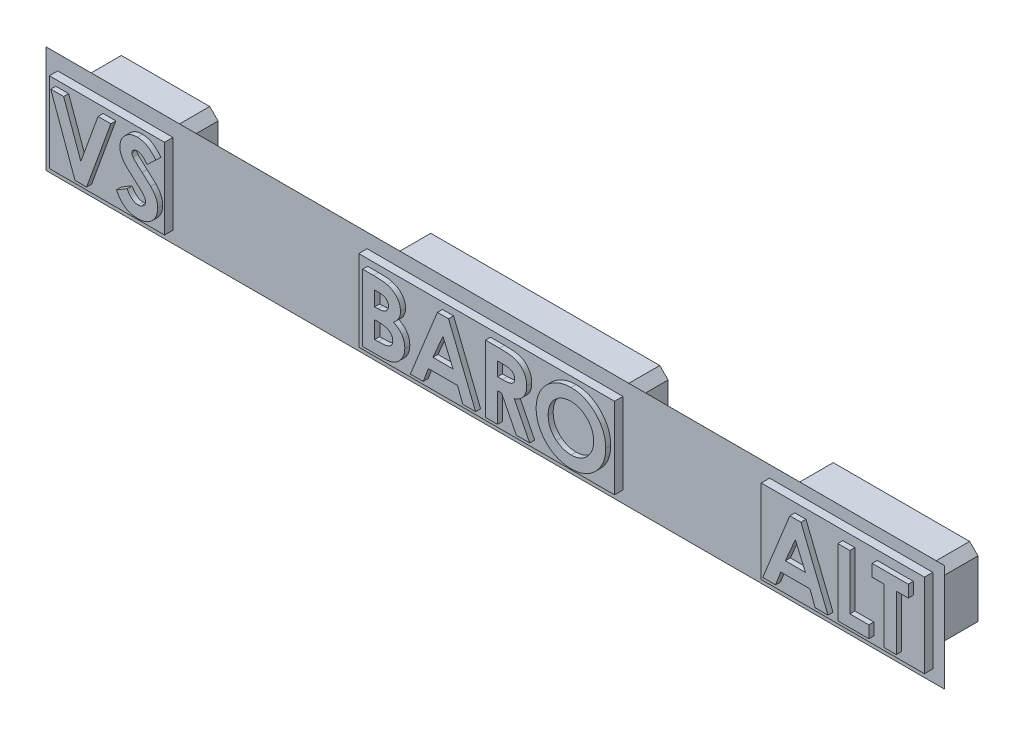
from build123d import *

# Parameters (mm, degrees)
ESQUISSE1_W                   = 160
ESQUISSE1_H                   = 41
BOSS_EXTRU_1_DEPTH            = 4
ESQUISSE2_R                   = 4
ENL_V_MAT_EXTRU_1_DEPTH       = 4
ESQUISSE4_W                   = 3
ESQUISSE4_H                   = 41
BOSS_EXTRU_2_DEPTH            = 50
ENL_V_MAT_EXTRU_2_DEPTH       = 173.571724219
CHANFREIN1_SIZE               = 0.2
ESQUISSE9_R                   = 1.25
ESQUISSE9_R_2                 = 1.375
ENL_V_MAT_EXTRU_3_DEPTH       = 900
ENL_V_START                   = -1
ESQUISSE10_W                  = 4.171279912
ESQUISSE10_H                  = 57.921201065
ESQUISSE10_W_2                = 8.342559824
ESQUISSE10_H_2                = 64.595248924
ENL_V_MAT_EXTRU_5_DEPTH       = 173.772840225
ESQUISSE11_W                  = 14.2
ESQUISSE11_H                  = 13.6
ESQUISSE11_W_2                = 12.8
ESQUISSE11_H_2                = 12.2
BOSS_EXTRU_4_DEPTH            = 8
ESQUISSE7_R                   = 2.5
ESQUISSE7_R_2                 = 1.25
BOSS_EXTRU_3_DEPTH            = 11
ESQUISSE7_3_R                 = 2.5
ESQUISSE7_3_R_2               = 1.25
BOSS_EXTRU_12_DEPTH           = 10.5
ESQUISSE12_W                  = 148
ESQUISSE12_H                  = 1
BOSS_EXTRU_5_DEPTH            = 7
ESQUISSE14_W                  = 8.279282425
ESQUISSE14_H                  = 6.197970863
ESQUISSE14_W_2                = 6.879282425
ESQUISSE14_H_2                = 4.797970863
ESQUISSE14_W_3                = 16.678738338
ESQUISSE14_H_3                = 6.241410903
ESQUISSE14_W_4                = 15.278738338
ESQUISSE14_H_4                = 4.841410903
ESQUISSE14_W_5                = 11.14782764
ESQUISSE14_H_5                = 6.395979727
ESQUISSE14_W_6                = 9.74782764
ESQUISSE14_H_6                = 4.995979727
BOSS_EXTRU_7_DEPTH            = 8
ESQUISSE15_W                  = 9.74782764
ESQUISSE15_H                  = 4.995979727
ESQUISSE15_W_2                = 15.278738338
ESQUISSE15_H_2                = 4.841410903
ESQUISSE15_W_3                = 6.879282425
ESQUISSE15_H_3                = 4.797970863
ENL_V_MAT_EXTRU_7_DEPTH       = 3.7
CHANFREIN2_SIZE               = 0.5
ESQUISSE16_W                  = 6.879282425
ESQUISSE16_H                  = 4.797970863
ESQUISSE16_W_2                = 15.278738338
ESQUISSE16_H_2                = 4.841410903
ESQUISSE16_W_3                = 9.74782764
ESQUISSE16_H_3                = 4.995979727
BOSS_EXTRU_10_DEPTH           = 0.5
ESQUISSE16_3_W                = 6.879282425
ESQUISSE16_3_H                = 4.797970863
ESQUISSE16_3_W_2              = 15.278738338
ESQUISSE16_3_H_2              = 4.841410903
ESQUISSE16_3_W_3              = 9.74782764
ESQUISSE16_3_H_3              = 4.995979727
ENL_V_MAT_EXTRU_10_DEPTH      = 0.2
BOSS_EXTRU_11_DEPTH           = 0.3
ENL_V_MAT_EXTRU_11_DEPTH      = 0.3
ENL_V_MAT_EXTRU_12_DEPTH      = 173.571724219
ENL_V_MAT_EXTRU_12_DEPTH_BACK = 173.571724219
ESQUISSE17_OUTSIDE_W          = 196.804
ESQUISSE17_OUTSIDE_H          = 77.804
ESQUISSE17_OUTSIDE_W_2        = 53.669783626
ESQUISSE17_OUTSIDE_H_2        = 6.395979727
ESQUISSE18_W                  = 61.820328171
ESQUISSE18_H                  = 17.181375288
ENL_V_MAT_EXTRU_13_DEPTH      = 20
BOSS_EXTRU_13_DEPTH           = 3


with BuildPart() as part:
    # Esquisse1 → Boss.-Extru.1 (new body)
    with BuildSketch(Plane.XY):
        with Locations((80, 20.5)):
            Rectangle(ESQUISSE1_W, ESQUISSE1_H)
    extrude(amount=BOSS_EXTRU_1_DEPTH)

    # Esquisse2 → Enlèv. mat.-Extru.1 (cut)
    with BuildSketch(Plane.XY.offset(4)):
        with Locations((138.32, 13)):
            Circle(ESQUISSE2_R)
        with BuildLine():
            Line((7.1, 2.95), (16.7, 2.95))
            ThreePointArc((16.7, 2.95), (17.407106781, 3.242893219), (17.7, 3.95))
            Line((17.7, 3.95), (17.7, 9.55))
            ThreePointArc((17.7, 9.55), (17.407106781, 10.257106781), (16.7, 10.55))
            Line((16.7, 10.55), (7.1, 10.55))
            ThreePointArc((7.1, 10.55), (6.392893219, 10.257106781), (6.1, 9.55))
            Line((6.1, 9.55), (6.1, 3.95))
            ThreePointArc((6.1, 3.95), (6.392893219, 3.242893219), (7.1, 2.95))
        make_face()
        with BuildLine():
            Line((49.030194036, 10.55), (58.630194036, 10.55))
            ThreePointArc((58.630194036, 10.55), (59.337300817, 10.257106781), (59.630194036, 9.55))
            Line((59.630194036, 9.55), (59.630194036, 3.95))
            ThreePointArc((59.630194036, 3.95), (59.337300817, 3.242893219), (58.630194036, 2.95))
            Line((58.630194036, 2.95), (49.030194036, 2.95))
            ThreePointArc((49.030194036, 2.95), (48.323087255, 3.242893219), (48.030194036, 3.95))
            Line((48.030194036, 3.95), (48.030194036, 9.55))
            ThreePointArc((48.030194036, 9.55), (48.323087255, 10.257106781), (49.030194036, 10.55))
        make_face()
        with BuildLine():
            Line((34.030194036, 10.55), (43.630194036, 10.55))
            ThreePointArc((43.630194036, 10.55), (44.337300817, 10.257106781), (44.630194036, 9.55))
            Line((44.630194036, 9.55), (44.630194036, 3.95))
            ThreePointArc((44.630194036, 3.95), (44.337300817, 3.242893219), (43.630194036, 2.95))
            Line((43.630194036, 2.95), (34.030194036, 2.95))
            ThreePointArc((34.030194036, 2.95), (33.323087255, 3.242893219), (33.030194036, 3.95))
            Line((33.030194036, 3.95), (33.030194036, 9.55))
            ThreePointArc((33.030194036, 9.55), (33.323087255, 10.257106781), (34.030194036, 10.55))
        make_face()
        with BuildLine():
            Line((64.030194036, 10.55), (73.630194036, 10.55))
            ThreePointArc((73.630194036, 10.55), (74.337300817, 10.257106781), (74.630194036, 9.55))
            Line((74.630194036, 9.55), (74.630194036, 3.95))
            ThreePointArc((74.630194036, 3.95), (74.337300817, 3.242893219), (73.630194036, 2.95))
            Line((73.630194036, 2.95), (64.030194036, 2.95))
            ThreePointArc((64.030194036, 2.95), (63.323087255, 3.242893219), (63.030194036, 3.95))
            Line((63.030194036, 3.95), (63.030194036, 9.55))
            ThreePointArc((63.030194036, 9.55), (63.323087255, 10.257106781), (64.030194036, 10.55))
        make_face()
        with BuildLine():
            Line((79.030194036, 10.55), (88.630194036, 10.55))
            ThreePointArc((88.630194036, 10.55), (89.337300817, 10.257106781), (89.630194036, 9.55))
            Line((89.630194036, 9.55), (89.630194036, 3.95))
            ThreePointArc((89.630194036, 3.95), (89.337300817, 3.242893219), (88.630194036, 2.95))
            Line((88.630194036, 2.95), (79.030194036, 2.95))
            ThreePointArc((79.030194036, 2.95), (78.323087255, 3.242893219), (78.030194036, 3.95))
            Line((78.030194036, 3.95), (78.030194036, 9.55))
            ThreePointArc((78.030194036, 9.55), (78.323087255, 10.257106781), (79.030194036, 10.55))
        make_face()
        with BuildLine():
            Line((112.45409437, 10.55), (122.05409437, 10.55))
            ThreePointArc((122.05409437, 10.55), (122.761201151, 10.257106781), (123.05409437, 9.55))
            Line((123.05409437, 9.55), (123.05409437, 3.95))
            ThreePointArc((123.05409437, 3.95), (122.761201151, 3.242893219), (122.05409437, 2.95))
            Line((122.05409437, 2.95), (112.45409437, 2.95))
            ThreePointArc((112.45409437, 2.95), (111.746987589, 3.242893219), (111.45409437, 3.95))
            Line((111.45409437, 3.95), (111.45409437, 9.55))
            ThreePointArc((111.45409437, 9.55), (111.746987589, 10.257106781), (112.45409437, 10.55))
        make_face()
        with BuildLine():
            Line((122.089585492, 31.2), (131.689585492, 31.2))
            ThreePointArc((131.689585492, 31.2), (132.396692273, 31.492893219), (132.689585492, 32.2))
            Line((132.689585492, 32.2), (132.689585492, 37.8))
            ThreePointArc((132.689585492, 37.8), (132.396692273, 38.507106781), (131.689585492, 38.8))
            Line((131.689585492, 38.8), (122.089585492, 38.8))
            ThreePointArc((122.089585492, 38.8), (121.382478711, 38.507106781), (121.089585492, 37.8))
            Line((121.089585492, 37.8), (121.089585492, 32.2))
            ThreePointArc((121.089585492, 32.2), (121.382478711, 31.492893219), (122.089585492, 31.2))
        make_face()
        with BuildLine():
            Line((144.95, 31.2), (154.55, 31.2))
            ThreePointArc((154.55, 31.2), (155.257106781, 31.492893219), (155.55, 32.2))
            Line((155.55, 32.2), (155.55, 37.8))
            ThreePointArc((155.55, 37.8), (155.257106781, 38.507106781), (154.55, 38.8))
            Line((154.55, 38.8), (144.95, 38.8))
            ThreePointArc((144.95, 38.8), (144.242893219, 38.507106781), (143.95, 37.8))
            Line((143.95, 37.8), (143.95, 32.2))
            ThreePointArc((143.95, 32.2), (144.242893219, 31.492893219), (144.95, 31.2))
        make_face()
        with BuildLine():
            Line((112.45409437, 22.55), (122.05409437, 22.55))
            ThreePointArc((122.05409437, 22.55), (122.761201151, 22.257106781), (123.05409437, 21.55))
            Line((123.05409437, 21.55), (123.05409437, 15.95))
            ThreePointArc((123.05409437, 15.95), (122.761201151, 15.242893219), (122.05409437, 14.95))
            Line((122.05409437, 14.95), (112.45409437, 14.95))
            ThreePointArc((112.45409437, 14.95), (111.746987589, 15.242893219), (111.45409437, 15.95))
            Line((111.45409437, 15.95), (111.45409437, 21.55))
            ThreePointArc((111.45409437, 21.55), (111.746987589, 22.257106781), (112.45409437, 22.55))
        make_face()
        Polygon((32, 38), (63.5, 38), (93, 38), (93, 23), (63.5, 23), (32, 23), align=None)
        with BuildLine():
            Line((94.030194036, 10.55), (103.630194036, 10.55))
            ThreePointArc((103.630194036, 10.55), (104.337300817, 10.257106781), (104.630194036, 9.55))
            Line((104.630194036, 9.55), (104.630194036, 3.95))
            ThreePointArc((104.630194036, 3.95), (104.337300817, 3.242893219), (103.630194036, 2.95))
            Line((103.630194036, 2.95), (94.030194036, 2.95))
            ThreePointArc((94.030194036, 2.95), (93.323087255, 3.242893219), (93.030194036, 3.95))
            Line((93.030194036, 3.95), (93.030194036, 9.55))
            ThreePointArc((93.030194036, 9.55), (93.323087255, 10.257106781), (94.030194036, 10.55))
        make_face()
    extrude(amount=-ENL_V_MAT_EXTRU_1_DEPTH, mode=Mode.SUBTRACT)

    # Esquisse4 → Boss.-Extru.2 (add)
    with BuildSketch(Plane(origin=(0, 0, 0), x_dir=(-1, 0, 0), z_dir=(0, 0, -1))):
        with Locations((-158.5, 20.5)):
            Rectangle(ESQUISSE4_W, ESQUISSE4_H)
        with Locations((-1.5, 20.5)):
            Rectangle(ESQUISSE4_W, ESQUISSE4_H)
    extrude(amount=BOSS_EXTRU_2_DEPTH)

    # Esquisse5 → Enlèv. mat.-Extru.2 (cut, through all)
    with BuildSketch(Plane(origin=(160, 0, 0), x_dir=(0, 0, -1), z_dir=(1, 0, 0))):
        with BuildLine():
            Line((50, 13), (2, 13))
            ThreePointArc((2, 13), (1.292893219, 12.707106781), (1, 12))
            Line((1, 12), (1, 11))
            ThreePointArc((1, 11), (1.292893219, 10.292893219), (2, 10))
            Line((2, 10), (50, 10))
            Line((50, 10), (50, 13))
        make_face()
        with BuildLine():
            Line((50, 31), (2, 31))
            ThreePointArc((2, 31), (1.292893219, 30.707106781), (1, 30))
            Line((1, 30), (1, 29))
            ThreePointArc((1, 29), (1.292893219, 28.292893219), (2, 28))
            Line((2, 28), (50, 28))
            Line((50, 28), (50, 31))
        make_face()
    extrude(amount=-ENL_V_MAT_EXTRU_2_DEPTH, mode=Mode.SUBTRACT)

    # Chanfrein1
    chanfrein1_edges = [part.edges().sort_by_distance(p)[0] for p in [
        (93, 30.5, 4),
        (62.5, 23, 4),
        (32, 30.5, 4),
        (62.5, 38, 4),
        (149.75, 31.2, 4),
        (155.257106781, 31.492893219, 4),
        (144.242893219, 31.492893219, 4),
        (155.55, 35, 4),
        (143.95, 35, 4),
        (155.257106781, 38.507106781, 4),
        (144.242893219, 38.507106781, 4),
        (149.75, 38.8, 4),
        (126.889585492, 31.2, 4),
        (132.396692273, 31.492893219, 4),
        (121.382478711, 31.492893219, 4),
        (132.689585492, 35, 4),
        (121.089585492, 35, 4),
        (132.396692273, 38.507106781, 4),
        (121.382478711, 38.507106781, 4),
        (126.889585492, 38.8, 4),
        (11.9, 2.95, 4),
        (17.407106781, 3.242893219, 4),
        (6.392893219, 3.242893219, 4),
        (17.7, 6.75, 4),
        (6.1, 6.75, 4),
        (17.407106781, 10.257106781, 4),
        (6.392893219, 10.257106781, 4),
        (11.9, 10.55, 4),
        (134.32, 13, 4),
        (123.05409437, 18.75, 4),
        (122.761201151, 22.257106781, 4),
        (122.761201151, 15.242893219, 4),
        (117.25409437, 22.55, 4),
        (117.25409437, 14.95, 4),
        (111.746987589, 22.257106781, 4),
        (111.746987589, 15.242893219, 4),
        (111.45409437, 18.75, 4),
        (123.05409437, 6.75, 4),
        (122.761201151, 10.257106781, 4),
        (122.761201151, 3.242893219, 4),
        (117.25409437, 10.55, 4),
        (117.25409437, 2.95, 4),
        (111.746987589, 10.257106781, 4),
        (111.746987589, 3.242893219, 4),
        (111.45409437, 6.75, 4),
        (104.630194036, 6.75, 4),
        (104.337300817, 10.257106781, 4),
        (104.337300817, 3.242893219, 4),
        (98.830194036, 10.55, 4),
        (98.830194036, 2.95, 4),
        (93.323087255, 10.257106781, 4),
        (93.323087255, 3.242893219, 4),
        (93.030194036, 6.75, 4),
        (89.630194036, 6.75, 4),
        (89.337300817, 10.257106781, 4),
        (89.337300817, 3.242893219, 4),
        (83.830194036, 10.55, 4),
        (83.830194036, 2.95, 4),
        (78.323087255, 10.257106781, 4),
        (78.323087255, 3.242893219, 4),
        (78.030194036, 6.75, 4),
        (74.630194036, 6.75, 4),
        (74.337300817, 10.257106781, 4),
        (74.337300817, 3.242893219, 4),
        (68.830194036, 10.55, 4),
        (68.830194036, 2.95, 4),
        (63.323087255, 10.257106781, 4),
        (63.323087255, 3.242893219, 4),
        (63.030194036, 6.75, 4),
        (59.630194036, 6.75, 4),
        (59.337300817, 10.257106781, 4),
        (59.337300817, 3.242893219, 4),
        (53.830194036, 10.55, 4),
        (53.830194036, 2.95, 4),
        (48.323087255, 10.257106781, 4),
        (48.323087255, 3.242893219, 4),
        (48.030194036, 6.75, 4),
        (44.630194036, 6.75, 4),
        (44.337300817, 10.257106781, 4),
        (44.337300817, 3.242893219, 4),
        (38.830194036, 10.55, 4),
        (38.830194036, 2.95, 4),
        (33.323087255, 10.257106781, 4),
        (33.323087255, 3.242893219, 4),
        (33.030194036, 6.75, 4),
    ]]
    chamfer(chanfrein1_edges, length=CHANFREIN1_SIZE)

    # Esquisse9 → Enlèv. mat.-Extru.3 (cut)
    with BuildSketch(Plane(origin=(160, 0, 0), x_dir=(0, 0, -1), z_dir=(1, 0, 0))):
        with Locations((5, 20.5)):
            Circle(ESQUISSE9_R)
        with Locations((45, 20.5)):
            Circle(ESQUISSE9_R_2)
    extrude(amount=-ENL_V_MAT_EXTRU_3_DEPTH, mode=Mode.SUBTRACT)

    # Esquisse10 → Enlèv. mat.-Extru.5 (cut, through all)
    with BuildSketch(Plane.XY.offset(4).offset(ENL_V_START)):
        with Locations((-1.585639956, 24.108169502)):
            Rectangle(ESQUISSE10_W, ESQUISSE10_H)
        with Locations((163.671279912, 22.797195815)):
            Rectangle(ESQUISSE10_W_2, ESQUISSE10_H_2)
    extrude(amount=-ENL_V_MAT_EXTRU_5_DEPTH, mode=Mode.SUBTRACT)

    # Esquisse11 → Boss.-Extru.4 (add)
    # profile 1 of 7: a face of its own
    with BuildSketch(Plane(origin=(0, 0, 0), x_dir=(-1, 0, 0), z_dir=(0, 0, -1))):
        with Locations((-11.9, 8.45)):
            Rectangle(ESQUISSE11_W, ESQUISSE11_H)
        with Locations((-11.9, 8.45)):
            Rectangle(ESQUISSE11_W_2, ESQUISSE11_H_2, mode=Mode.SUBTRACT)
    # profile 2 of 7: a face of its own
    with BuildSketch(Plane(origin=(0, 0, 0), x_dir=(-1, 0, 0), z_dir=(0, 0, -1))):
        with Locations((-38.830194036, 8.45)):
            Rectangle(ESQUISSE11_W, ESQUISSE11_H)
        with Locations((-38.830194036, 8.45)):
            Rectangle(ESQUISSE11_W_2, ESQUISSE11_H_2, mode=Mode.SUBTRACT)
    # profile 3 of 7: a face of its own
    with BuildSketch(Plane(origin=(0, 0, 0), x_dir=(-1, 0, 0), z_dir=(0, 0, -1))):
        with Locations((-53.830194036, 8.45)):
            Rectangle(ESQUISSE11_W, ESQUISSE11_H)
        with Locations((-53.830194036, 8.45)):
            Rectangle(ESQUISSE11_W_2, ESQUISSE11_H_2, mode=Mode.SUBTRACT)
    # profile 4 of 7: a face of its own
    with BuildSketch(Plane(origin=(0, 0, 0), x_dir=(-1, 0, 0), z_dir=(0, 0, -1))):
        with Locations((-68.830194036, 8.45)):
            Rectangle(ESQUISSE11_W, ESQUISSE11_H)
        with Locations((-68.830194036, 8.45)):
            Rectangle(ESQUISSE11_W_2, ESQUISSE11_H_2, mode=Mode.SUBTRACT)
    # profile 5 of 7: a face of its own
    with BuildSketch(Plane(origin=(0, 0, 0), x_dir=(-1, 0, 0), z_dir=(0, 0, -1))):
        with Locations((-83.830194036, 8.45)):
            Rectangle(ESQUISSE11_W, ESQUISSE11_H)
        with Locations((-83.830194036, 8.45)):
            Rectangle(ESQUISSE11_W_2, ESQUISSE11_H_2, mode=Mode.SUBTRACT)
    # profile 6 of 7: a face of its own
    with BuildSketch(Plane(origin=(0, 0, 0), x_dir=(-1, 0, 0), z_dir=(0, 0, -1))):
        with Locations((-98.830194036, 8.45)):
            Rectangle(ESQUISSE11_W, ESQUISSE11_H)
        with Locations((-98.830194036, 8.45)):
            Rectangle(ESQUISSE11_W_2, ESQUISSE11_H_2, mode=Mode.SUBTRACT)
    # profile 7 of 7: a face of its own
    with BuildSketch(Plane(origin=(0, 0, 0), x_dir=(-1, 0, 0), z_dir=(0, 0, -1))):
        with Locations((-126.889585492, 33.3)):
            Rectangle(ESQUISSE11_W, ESQUISSE11_H)
        with Locations((-126.889585492, 33.3)):
            Rectangle(ESQUISSE11_W_2, ESQUISSE11_H_2, mode=Mode.SUBTRACT)
    extrude(amount=BOSS_EXTRU_4_DEPTH)

    # Esquisse7 → Boss.-Extru.3 (add)
    # profile 1 of 4: a face of its own
    with BuildSketch(Plane(origin=(0, 0, 0), x_dir=(-1, 0, 0), z_dir=(0, 0, -1))):
        with Locations((-9.121504758, 34.424873109)):
            Circle(ESQUISSE7_R)
        with Locations((-9.121504758, 34.424873109)):
            Circle(ESQUISSE7_R_2, mode=Mode.SUBTRACT)
    # profile 2 of 4: a face of its own
    with BuildSketch(Plane(origin=(0, 0, 0), x_dir=(-1, 0, 0), z_dir=(0, 0, -1))):
        with Locations((-24.98168427, 6.75)):
            Circle(ESQUISSE7_R)
        with Locations((-24.98168427, 6.75)):
            Circle(ESQUISSE7_R_2, mode=Mode.SUBTRACT)
    # profile 3 of 4: a face of its own
    with BuildSketch(Plane(origin=(0, 0, 0), x_dir=(-1, 0, 0), z_dir=(0, 0, -1))):
        with Locations((-138.246159037, 33.067084724)):
            Circle(ESQUISSE7_R)
        with Locations((-138.246159037, 33.067084724)):
            Circle(ESQUISSE7_R_2, mode=Mode.SUBTRACT)
    # profile 4 of 4: a face of its own
    with BuildSketch(Plane(origin=(0, 0, 0), x_dir=(-1, 0, 0), z_dir=(0, 0, -1))):
        with Locations((-152.183195484, 6.75)):
            Circle(ESQUISSE7_R)
        with Locations((-152.183195484, 6.75)):
            Circle(ESQUISSE7_R_2, mode=Mode.SUBTRACT)
    extrude(amount=BOSS_EXTRU_3_DEPTH)

    # Esquisse7<3> → Boss.-Extru.12 (add)
    # profile 1 of 7: a face of its own
    with BuildSketch(Plane(origin=(0, 0, 0), x_dir=(-1, 0, 0), z_dir=(0, 0, -1))):
        with Locations((-9.121504758, 34.424873109)):
            Circle(ESQUISSE7_3_R)
        with Locations((-9.121504758, 34.424873109)):
            Circle(ESQUISSE7_3_R_2, mode=Mode.SUBTRACT)
    # profile 2 of 7: a face of its own
    with BuildSketch(Plane(origin=(0, 0, 0), x_dir=(-1, 0, 0), z_dir=(0, 0, -1))):
        with Locations((-24.98168427, 6.75)):
            Circle(ESQUISSE7_3_R)
        with Locations((-24.98168427, 6.75)):
            Circle(ESQUISSE7_3_R_2, mode=Mode.SUBTRACT)
    # profile 3 of 7: a face of its own
    with BuildSketch(Plane(origin=(0, 0, 0), x_dir=(-1, 0, 0), z_dir=(0, 0, -1))):
        with Locations((-138.246159037, 33.067084724)):
            Circle(ESQUISSE7_3_R)
        with Locations((-138.246159037, 33.067084724)):
            Circle(ESQUISSE7_3_R_2, mode=Mode.SUBTRACT)
    # profile 4 of 7: a face of its own
    with BuildSketch(Plane(origin=(0, 0, 0), x_dir=(-1, 0, 0), z_dir=(0, 0, -1))):
        with Locations((-152.183195484, 6.75)):
            Circle(ESQUISSE7_3_R)
        with Locations((-152.183195484, 6.75)):
            Circle(ESQUISSE7_3_R_2, mode=Mode.SUBTRACT)
    # profile 5 of 7: a face of its own
    with BuildSketch(Plane(origin=(0, 0, 0), x_dir=(-1, 0, 0), z_dir=(0, 0, -1))):
        with Locations((-73.299586821, 18.635920155)):
            Circle(ESQUISSE7_3_R)
        with Locations((-73.299586821, 18.635920155)):
            Circle(ESQUISSE7_3_R_2, mode=Mode.SUBTRACT)
    # profile 6 of 7: a face of its own
    with BuildSketch(Plane(origin=(0, 0, 0), x_dir=(-1, 0, 0), z_dir=(0, 0, -1))):
        with Locations((-103.528260194, 18.635920155)):
            Circle(ESQUISSE7_3_R)
        with Locations((-103.528260194, 18.635920155)):
            Circle(ESQUISSE7_3_R_2, mode=Mode.SUBTRACT)
    # profile 7 of 7: a face of its own
    with BuildSketch(Plane(origin=(0, 0, 0), x_dir=(-1, 0, 0), z_dir=(0, 0, -1))):
        with Locations((-45.928753513, 18.635920155)):
            Circle(ESQUISSE7_3_R)
        with Locations((-45.928753513, 18.635920155)):
            Circle(ESQUISSE7_3_R_2, mode=Mode.SUBTRACT)
    extrude(amount=BOSS_EXTRU_12_DEPTH)

    # Esquisse12 → Boss.-Extru.5 (add)
    with BuildSketch(Plane(origin=(0, 0, 0), x_dir=(-1, 0, 0), z_dir=(0, 0, -1))):
        with Locations((-80, 40)):
            Rectangle(ESQUISSE12_W, ESQUISSE12_H)
        with Locations((-80, 1)):
            Rectangle(ESQUISSE12_W, ESQUISSE12_H)
    extrude(amount=BOSS_EXTRU_5_DEPTH)

    # Esquisse14 → Boss.-Extru.7 (add)
    # profile 1 of 3: a face of its own
    with BuildSketch(Plane(origin=(0, 0, 0), x_dir=(-1, 0, 0), z_dir=(0, 0, -1))):
        with Locations((-39.983624666, 19.009843626)):
            Rectangle(ESQUISSE14_W, ESQUISSE14_H)
        with Locations((-39.983624666, 19.009843626)):
            Rectangle(ESQUISSE14_W_2, ESQUISSE14_H_2, mode=Mode.SUBTRACT)
    # profile 2 of 3: a face of its own
    with BuildSketch(Plane(origin=(0, 0, 0), x_dir=(-1, 0, 0), z_dir=(0, 0, -1))):
        with Locations((-62.664411353, 19.031563646)):
            Rectangle(ESQUISSE14_W_3, ESQUISSE14_H_3)
        with Locations((-62.664411353, 19.031563646)):
            Rectangle(ESQUISSE14_W_4, ESQUISSE14_H_4, mode=Mode.SUBTRACT)
    # profile 3 of 3: a face of its own
    with BuildSketch(Plane(origin=(0, 0, 0), x_dir=(-1, 0, 0), z_dir=(0, 0, -1))):
        with Locations((-83.939853259, 19.108848058)):
            Rectangle(ESQUISSE14_W_5, ESQUISSE14_H_5)
        with Locations((-83.939853259, 19.108848058)):
            Rectangle(ESQUISSE14_W_6, ESQUISSE14_H_6, mode=Mode.SUBTRACT)
    extrude(amount=BOSS_EXTRU_7_DEPTH)

    # Esquisse15 → Enlèv. mat.-Extru.7 (cut)
    with BuildSketch(Plane(origin=(0, 0, 0), x_dir=(-1, 0, 0), z_dir=(0, 0, -1))):
        with Locations((-83.939853259, 19.108848058)):
            Rectangle(ESQUISSE15_W, ESQUISSE15_H)
        with Locations((-62.664411353, 19.031563646)):
            Rectangle(ESQUISSE15_W_2, ESQUISSE15_H_2)
        with Locations((-39.983624666, 19.009843626)):
            Rectangle(ESQUISSE15_W_3, ESQUISSE15_H_3)
    extrude(amount=-ENL_V_MAT_EXTRU_7_DEPTH, mode=Mode.SUBTRACT)

    # Chanfrein2
    chanfrein2_edges = [part.edges().sort_by_distance(p)[0] for p in [
        (32, 30.5, 0),
        (62.5, 38, 0),
        (93, 30.5, 0),
        (62.5, 23, 0),
        (11.9, 2.95, 0),
        (17.407106781, 3.242893219, 0),
        (6.392893219, 3.242893219, 0),
        (17.7, 6.75, 0),
        (6.1, 6.75, 0),
        (17.407106781, 10.257106781, 0),
        (6.392893219, 10.257106781, 0),
        (11.9, 10.55, 0),
        (38.830194036, 2.95, 0),
        (44.337300817, 3.242893219, 0),
        (33.323087255, 3.242893219, 0),
        (44.630194036, 6.75, 0),
        (33.030194036, 6.75, 0),
        (44.337300817, 10.257106781, 0),
        (33.323087255, 10.257106781, 0),
        (38.830194036, 10.55, 0),
        (53.830194036, 2.95, 0),
        (59.337300817, 3.242893219, 0),
        (48.323087255, 3.242893219, 0),
        (59.630194036, 6.75, 0),
        (48.030194036, 6.75, 0),
        (59.337300817, 10.257106781, 0),
        (48.323087255, 10.257106781, 0),
        (53.830194036, 10.55, 0),
        (68.830194036, 2.95, 0),
        (74.337300817, 3.242893219, 0),
        (63.323087255, 3.242893219, 0),
        (74.630194036, 6.75, 0),
        (63.030194036, 6.75, 0),
        (74.337300817, 10.257106781, 0),
        (63.323087255, 10.257106781, 0),
        (68.830194036, 10.55, 0),
        (83.830194036, 2.95, 0),
        (89.337300817, 3.242893219, 0),
        (78.323087255, 3.242893219, 0),
        (89.630194036, 6.75, 0),
        (78.030194036, 6.75, 0),
        (89.337300817, 10.257106781, 0),
        (78.323087255, 10.257106781, 0),
        (83.830194036, 10.55, 0),
        (98.830194036, 10.55, 0),
        (93.323087255, 10.257106781, 0),
        (104.337300817, 10.257106781, 0),
        (93.030194036, 6.75, 0),
        (104.630194036, 6.75, 0),
        (93.323087255, 3.242893219, 0),
        (104.337300817, 3.242893219, 0),
        (98.830194036, 2.95, 0),
        (117.25409437, 10.55, 0),
        (111.746987589, 10.257106781, 0),
        (122.761201151, 10.257106781, 0),
        (111.45409437, 6.75, 0),
        (123.05409437, 6.75, 0),
        (111.746987589, 3.242893219, 0),
        (122.761201151, 3.242893219, 0),
        (117.25409437, 2.95, 0),
        (134.32, 13, 0),
        (117.25409437, 22.55, 0),
        (111.746987589, 22.257106781, 0),
        (122.761201151, 22.257106781, 0),
        (111.45409437, 18.75, 0),
        (123.05409437, 18.75, 0),
        (111.746987589, 15.242893219, 0),
        (122.761201151, 15.242893219, 0),
        (117.25409437, 14.95, 0),
        (126.889585492, 38.8, 0),
        (121.382478711, 38.507106781, 0),
        (132.396692273, 38.507106781, 0),
        (121.089585492, 35, 0),
        (132.689585492, 35, 0),
        (121.382478711, 31.492893219, 0),
        (132.396692273, 31.492893219, 0),
        (126.889585492, 31.2, 0),
        (149.75, 38.8, 0),
        (144.242893219, 38.507106781, 0),
        (155.257106781, 38.507106781, 0),
        (143.95, 35, 0),
        (155.55, 35, 0),
        (144.242893219, 31.492893219, 0),
        (155.257106781, 31.492893219, 0),
        (149.75, 31.2, 0),
    ]]
    chamfer(chanfrein2_edges, length=CHANFREIN2_SIZE)

    # Esquisse16 → Boss.-Extru.10 (add)
    with BuildSketch(Plane.XY.offset(4)):
        with Locations((39.983624666, 19.009843626)):
            Rectangle(ESQUISSE16_W, ESQUISSE16_H)
        with Locations((62.664411353, 19.031563646)):
            Rectangle(ESQUISSE16_W_2, ESQUISSE16_H_2)
        with Locations((83.939853259, 19.108848058)):
            Rectangle(ESQUISSE16_W_3, ESQUISSE16_H_3)
    extrude(amount=BOSS_EXTRU_10_DEPTH)

    # Esquisse16<3> → Enlèv. mat.-Extru.10 (cut)
    with BuildSketch(Plane.XY.offset(4)):
        with Locations((39.983624666, 19.009843626)):
            Rectangle(ESQUISSE16_3_W, ESQUISSE16_3_H)
        with Locations((62.664411353, 19.031563646)):
            Rectangle(ESQUISSE16_3_W_2, ESQUISSE16_3_H_2)
        with Locations((83.939853259, 19.108848058)):
            Rectangle(ESQUISSE16_3_W_3, ESQUISSE16_3_H_3)
    extrude(amount=-ENL_V_MAT_EXTRU_10_DEPTH, mode=Mode.SUBTRACT)


with BuildPart() as enl_v_mat_extru_10_piece_1:
    # of the separate pieces the step leaves, piece 1, a body of its own (enl_v_mat_extru_10_pieces)
    add(part.part.solids().sort_by_distance((33.030194036, 3.95, 0.5))[0])

    # Esquisse17 outside → Enlèv. mat.-Extru.12 (cut, two sides: drawn at the far end of the back side and taken through both)
    with BuildSketch(Plane(origin=(0, 0, 0), x_dir=(-1, 0, 0), z_dir=(0, 0, -1)).offset(-ENL_V_MAT_EXTRU_12_DEPTH_BACK)):
        with Locations((-80, 20.5)):
            Rectangle(ESQUISSE17_OUTSIDE_W, ESQUISSE17_OUTSIDE_H)
        with Locations((-62.678875266, 19.108848058)):
            Rectangle(ESQUISSE17_OUTSIDE_W_2, ESQUISSE17_OUTSIDE_H_2, mode=Mode.SUBTRACT)
    extrude(amount=ENL_V_MAT_EXTRU_12_DEPTH + ENL_V_MAT_EXTRU_12_DEPTH_BACK, mode=Mode.SUBTRACT)

    # Esquisse18 → Enlèv. mat.-Extru.13 (cut)
    with BuildSketch(Plane(origin=(0, 22.306837921, 0), x_dir=(1, 0, 0), z_dir=(0, 1, 0))):
        with Locations((63.343440324, 4.591687644)):
            Rectangle(ESQUISSE18_W, ESQUISSE18_H)
    extrude(amount=-ENL_V_MAT_EXTRU_13_DEPTH, mode=Mode.SUBTRACT)


with BuildPart() as enl_v_mat_extru_10_piece_2:
    # of the separate pieces the step leaves, piece 2, a body of its own (enl_v_mat_extru_10_pieces)
    add(part.part.solids().sort_by_distance((55.025042184, 16.610858194, 4.5))[0])



with BuildPart() as enl_v_mat_extru_10_piece_3:
    # of the separate pieces the step leaves, piece 3, a body of its own (enl_v_mat_extru_10_pieces)
    add(part.part.solids().sort_by_distance((79.065939439, 16.610858194, 4.5))[0])


with BuildPart() as enl_v_mat_extru_10_piece_4:
    # of the separate pieces the step leaves, piece 4, a body of its own (enl_v_mat_extru_10_pieces)
    add(part.part.solids().sort_by_distance((36.543983453, 16.610858194, 4.5))[0])


with BuildPart() as enl_v_mat_extru_10_piece_2_1:
    add(enl_v_mat_extru_10_piece_2.part)

    add(enl_v_mat_extru_10_piece_3.part)  # Boss.-Extru.11 merges Enlèv. mat.-Extru.10 piece 3

    add(enl_v_mat_extru_10_piece_4.part)  # Boss.-Extru.11 merges Enlèv. mat.-Extru.10 piece 4
    # Esquisse13 → Boss.-Extru.11 (add)
    # profile 1 of 9: a face of its own
    with BuildSketch(Plane.XY.offset(4.5)):
        Polygon((36.928205128, 21.061183811), (37.695032051, 21.061183811), (38.723076923, 18.219837658), (39.753525641, 21.061183811), (40.517948718, 21.061183811), (39.067628205, 17.061183811), (38.376121795, 17.061183811), align=None)
    # profile 2 of 9: a face of its own
    with BuildSketch(Plane.XY.offset(4.5)):
        with BuildLine():
            Line((43.21025641, 20.526728683), (42.673397436, 20.035542786))
            add(Edge.make_bspline(
                [(42.673397436, 20.035542786), (42.650400699, 20.067982073), (42.606250172, 20.130260982), (42.534686773, 20.213653908), (42.463446519, 20.28479428), (42.391869413, 20.343384906), (42.319321023, 20.389069805), (42.245927282, 20.421415218), (42.172104279, 20.441977504), (42.122506616, 20.444538003), (42.098076923, 20.445799196)],
                knots=[0, 0, 0, 0, 1.299362458, 2.494594718, 3.587462134, 4.587049575, 5.512617175, 6.380583204, 7.202344345, 8, 8, 8, 8], degree=3))
            add(Edge.make_bspline(
                [(42.098076923, 20.445799196), (42.075289606, 20.445000046), (42.031293283, 20.443457099), (41.968573261, 20.428120311), (41.912889533, 20.401651269), (41.864296442, 20.367040768), (41.825803545, 20.32534314), (41.795069952, 20.281613049), (41.777764356, 20.233344918), (41.775486599, 20.200192419), (41.774358974, 20.183779965)],
                knots=[0, 0, 0, 0, 1.185010067, 2.2879431, 3.333075148, 4.379039566, 5.372662701, 6.27520591, 7.14612461, 8, 8, 8, 8], degree=3))
            add(Edge.make_bspline(
                [(41.774358974, 20.183779965), (41.7750656, 20.167130837), (41.776488645, 20.133601805), (41.790233323, 20.084460834), (41.810950479, 20.036444385), (41.830746567, 20.007214488), (41.840865385, 19.992273555)],
                knots=[0, 0, 0, 0, 0.967525499, 1.948461899, 2.951351359, 4, 4, 4, 4], degree=3))
            add(Edge.make_bspline(
                [(41.840865385, 19.992273555), (41.850064485, 19.980660125), (41.871239598, 19.953927541), (41.911616203, 19.911587297), (41.962320739, 19.859716791), (42.025304423, 19.800099698), (42.097952629, 19.730591956), (42.183632696, 19.653925939), (42.279878378, 19.567727389), (42.348287579, 19.507701841), (42.384134615, 19.476247914)],
                knots=[0, 0, 0, 0, 0.473873513, 1.090794244, 1.870441696, 2.795289791, 3.865433203, 5.087734844, 6.473946851, 8, 8, 8, 8], degree=3))
            add(Edge.make_bspline(
                [(42.384134615, 19.476247914), (42.417782216, 19.447127613), (42.481638371, 19.391863331), (42.572492999, 19.313424557), (42.652339086, 19.242855104), (42.722339806, 19.18121407), (42.781434017, 19.127854698), (42.829870152, 19.082521931), (42.868239774, 19.046098316), (42.890050658, 19.02409843), (42.899358974, 19.014709452)],
                knots=[0, 0, 0, 0, 1.543621617, 2.929473131, 4.163658386, 5.240097082, 6.164993805, 6.925417477, 7.541396219, 8, 8, 8, 8], degree=3))
            add(Edge.make_bspline(
                [(42.899358974, 19.014709452), (42.934672785, 18.976492346), (43.002558331, 18.903025646), (43.09078561, 18.789175366), (43.163399514, 18.678034279), (43.219575007, 18.567511083), (43.262000999, 18.45601115), (43.291911886, 18.34079995), (43.309825715, 18.220673598), (43.311814568, 18.138702028), (43.312820513, 18.097241504)],
                knots=[0, 0, 0, 0, 1.206664779, 2.319633467, 3.337109185, 4.282041471, 5.190008762, 6.099243693, 7.03861361, 8, 8, 8, 8], degree=3))
            add(Edge.make_bspline(
                [(43.312820513, 18.097241504), (43.312104507, 18.056843308), (43.310699677, 17.977580544), (43.293493199, 17.861591295), (43.268957772, 17.750584551), (43.231021698, 17.64576822), (43.184785436, 17.545421775), (43.126821603, 17.451108295), (43.05875103, 17.361873288), (42.980731701, 17.279311939), (42.894433059, 17.204393238), (42.801869563, 17.13769884), (42.702136082, 17.08263412), (42.596084722, 17.03729225), (42.483772251, 17.002369336), (42.365332466, 16.976558048), (42.240584206, 16.961066519), (42.155279548, 16.959447064), (42.111698718, 16.958619709)],
                knots=[0, 0, 0, 0, 1.043214005, 2.046824704, 3.02475056, 3.976699089, 4.921714032, 5.875962561, 6.831408892, 7.817874052, 8.806269674, 9.781291748, 10.760897367, 11.74438705, 12.757449933, 13.795994037, 14.874007457, 16, 16, 16, 16], degree=3))
            add(Edge.make_bspline(
                [(42.111698718, 16.958619709), (42.077488138, 16.959226627), (42.009731569, 16.960428674), (41.90986863, 16.970242385), (41.813439674, 16.986080669), (41.720553319, 17.008781662), (41.630791095, 17.0375469), (41.544149317, 17.072682535), (41.461226101, 17.114733158), (41.381394011, 17.16283404), (41.305041129, 17.2186855), (41.231202003, 17.281145673), (41.160610074, 17.351175225), (41.092926303, 17.428608538), (41.028583749, 17.513664885), (40.965476249, 17.6051597), (40.906408492, 17.704791), (40.869919711, 17.774683164), (40.851282051, 17.810382529)],
                knots=[0, 0, 0, 0, 1.016823716, 2.013894106, 2.979844003, 3.91962641, 4.853723003, 5.779685073, 6.695824784, 7.614987388, 8.547259901, 9.504950863, 10.487499108, 11.500346958, 12.559593716, 13.656357062, 14.802919212, 16, 16, 16, 16], degree=3))
            Line((40.851282051, 17.810382529), (41.482692308, 18.18938894))
            add(Edge.make_bspline(
                [(41.482692308, 18.18938894), (41.506005234, 18.148865495), (41.550698107, 18.071178589), (41.626434357, 17.966796385), (41.704022279, 17.877410305), (41.785255637, 17.804600254), (41.869146661, 17.74739267), (41.956100567, 17.706508161), (42.046178446, 17.681200696), (42.107535405, 17.67811007), (42.138141026, 17.676568427)],
                knots=[0, 0, 0, 0, 1.283663364, 2.460892379, 3.537111102, 4.529833553, 5.449777664, 6.316464042, 7.160231139, 8, 8, 8, 8], degree=3))
            add(Edge.make_bspline(
                [(42.138141026, 17.676568427), (42.169271324, 17.677827416), (42.229668636, 17.680270039), (42.315878071, 17.702831807), (42.394918145, 17.738255438), (42.463239801, 17.788800075), (42.521090272, 17.847136268), (42.56378724, 17.91203795), (42.590609763, 17.982260004), (42.593445554, 18.031040861), (42.594871795, 18.055574837)],
                knots=[0, 0, 0, 0, 1.13588714, 2.203786484, 3.234766741, 4.283437687, 5.291419208, 6.222934724, 7.106237994, 8, 8, 8, 8], degree=3))
            add(Edge.make_bspline(
                [(42.594871795, 18.055574837), (42.59355472, 18.078399709), (42.590879209, 18.124766252), (42.57117222, 18.193705846), (42.540364184, 18.262614088), (42.503916106, 18.319134491), (42.466825622, 18.366457493), (42.431358753, 18.407460734), (42.38816949, 18.452762137), (42.33736734, 18.502418687), (42.279623533, 18.556867524), (42.214889427, 18.616103316), (42.142423748, 18.679604266), (42.091204863, 18.722860486), (42.064423077, 18.745478683)],
                knots=[0, 0, 0, 0, 0.916159276, 1.861089862, 2.860218735, 3.940849679, 4.552606315, 5.27541173, 6.11797699, 7.06649574, 8.129236253, 9.306560635, 10.591630461, 12, 12, 12, 12], degree=3))
            add(Edge.make_bspline(
                [(42.064423077, 18.745478683), (42.013509835, 18.788556168), (41.915791914, 18.871234899), (41.777704094, 18.993348783), (41.653274605, 19.107475396), (41.543578151, 19.215025594), (41.447217032, 19.314013173), (41.364843846, 19.405242148), (41.297363501, 19.489416227), (41.226354988, 19.58911479), (41.158882704, 19.71060434), (41.100567503, 19.856770351), (41.062735063, 20.002917817), (41.058496464, 20.101033176), (41.056410256, 20.149324837)],
                knots=[0, 0, 0, 0, 1.345494975, 2.582412109, 3.71882943, 4.751509156, 5.681369928, 6.505683931, 7.230279997, 7.856715994, 8.973648664, 10.023341002, 11.027102913, 12, 12, 12, 12], degree=3))
            add(Edge.make_bspline(
                [(41.056410256, 20.149324837), (41.057277907, 20.183570691), (41.058987273, 20.251038703), (41.074235075, 20.350240583), (41.097023497, 20.445962062), (41.130118828, 20.537853905), (41.173072572, 20.625801012), (41.225238225, 20.710233923), (41.287425822, 20.790375536), (41.357507045, 20.866172722), (41.43471861, 20.935442725), (41.517228979, 20.996580443), (41.604571137, 21.048218248), (41.696210768, 21.091055558), (41.792715724, 21.123844797), (41.89337506, 21.147087444), (41.998333151, 21.160911429), (42.069723379, 21.162790639), (42.106089744, 21.163747914)],
                knots=[0, 0, 0, 0, 1.010766082, 1.991317756, 2.957454644, 3.913069143, 4.869106762, 5.843196583, 6.838735724, 7.860187025, 8.887984031, 9.89767229, 10.887916223, 11.879572884, 12.879850636, 13.892031539, 14.926195476, 16, 16, 16, 16], degree=3))
            add(Edge.make_bspline(
                [(42.106089744, 21.163747914), (42.153218752, 21.162023834), (42.24710475, 21.158589285), (42.385917905, 21.131732227), (42.521504791, 21.089496676), (42.630763245, 21.03854413), (42.717698158, 20.989186374), (42.784325647, 20.94374397), (42.852122704, 20.891687254), (42.92163607, 20.832852182), (42.991574078, 20.766130222), (43.0639254, 20.693109745), (43.137704163, 20.613159683), (43.18564866, 20.556043729), (43.21025641, 20.526728683)],
                knots=[0, 0, 0, 0, 1.282922637, 2.555718331, 3.837320111, 5.142675274, 5.830281639, 6.55870424, 7.337177975, 8.157850921, 9.037902056, 9.96903443, 10.957596896, 12, 12, 12, 12], degree=3))
        make_face()
    # profile 3 of 9: a face of its own
    with BuildSketch(Plane.XY.offset(4.5)):
        with BuildLine():
            Line((55.561538462, 17.061183811), (55.561538462, 21.061183811))
            Line((55.561538462, 21.061183811), (56.202564103, 21.061183811))
            add(Edge.make_bspline(
                [(56.202564103, 21.061183811), (56.247439906, 21.061188933), (56.334273734, 21.061198843), (56.459552286, 21.056799471), (56.575737563, 21.051108391), (56.682459819, 21.044741397), (56.779900701, 21.033769792), (56.867912036, 21.02220692), (56.94666967, 21.008262808), (56.995361235, 20.995754508), (57.018269231, 20.989869709)],
                knots=[0, 0, 0, 0, 1.311965854, 2.538629056, 3.664479157, 4.713267157, 5.663616078, 6.530575999, 7.308677837, 8, 8, 8, 8], degree=3))
            add(Edge.make_bspline(
                [(57.018269231, 20.989869709), (57.048349755, 20.981569095), (57.107377399, 20.965280625), (57.191923823, 20.932385358), (57.2721279, 20.895819935), (57.347891703, 20.854105627), (57.418750011, 20.806738824), (57.48443354, 20.75334361), (57.546358919, 20.696063266), (57.602327322, 20.633301405), (57.652913536, 20.566981873), (57.696863886, 20.497122047), (57.735051108, 20.42479013), (57.765610887, 20.349075873), (57.788637107, 20.27032796), (57.805478388, 20.188882657), (57.816393819, 20.104482251), (57.817425184, 20.047061897), (57.817948718, 20.017914581)],
                knots=[0, 0, 0, 0, 1.099996261, 2.158545794, 3.195537121, 4.207578794, 5.205712374, 6.197378256, 7.190519799, 8.17788031, 9.159561366, 10.129234751, 11.085776129, 12.040971148, 13.00380137, 13.975669004, 14.972423361, 16, 16, 16, 16], degree=3))
            add(Edge.make_bspline(
                [(57.817948718, 20.017914581), (57.816579831, 19.98046793), (57.813885346, 19.9067588), (57.796672793, 19.798493424), (57.764396574, 19.696167082), (57.722163926, 19.597893938), (57.664740728, 19.504040552), (57.591824373, 19.414651549), (57.504595866, 19.326974508), (57.437686786, 19.274418035), (57.402884615, 19.247081247)],
                knots=[0, 0, 0, 0, 0.986156485, 1.941127874, 2.875419072, 3.804401753, 4.751181392, 5.761612777, 6.835722519, 8, 8, 8, 8], degree=3))
            add(Edge.make_bspline(
                [(57.402884615, 19.247081247), (57.431086625, 19.232684366), (57.486382964, 19.204456065), (57.56488752, 19.158057164), (57.637574169, 19.108706048), (57.704768817, 19.057395682), (57.765061978, 19.001950944), (57.820943259, 18.945566638), (57.869655767, 18.885012175), (57.91321596, 18.822445833), (57.951077771, 18.756961644), (57.984051234, 18.688670196), (58.011902735, 18.61733819), (58.035488107, 18.543328649), (58.053078084, 18.466387014), (58.064547122, 18.386485768), (58.073328535, 18.303897415), (58.074011647, 18.247640291), (58.074358974, 18.219036376)],
                knots=[0, 0, 0, 0, 1.164658916, 2.283573913, 3.35186032, 4.395461096, 5.390182219, 6.362969632, 7.312859996, 8.245001507, 9.165155236, 10.092416118, 11.032087915, 11.979892451, 12.947605196, 13.931445124, 14.948243989, 16, 16, 16, 16], degree=3))
            add(Edge.make_bspline(
                [(58.074358974, 18.219036376), (58.072105049, 18.164404533), (58.067656937, 18.056588811), (58.035134514, 17.898290569), (57.978750965, 17.748209479), (57.903039485, 17.606942025), (57.809748376, 17.47857767), (57.702490352, 17.36613161), (57.582345258, 17.270948516), (57.471496886, 17.206707311), (57.375621775, 17.163595456), (57.296210211, 17.136940988), (57.210923875, 17.11224833), (57.118200525, 17.094908635), (57.01972111, 17.079037439), (56.914525449, 17.069238235), (56.802810151, 17.062597555), (56.726079255, 17.061664587), (56.686538462, 17.061183811)],
                knots=[0, 0, 0, 0, 1.284142165, 2.534249414, 3.780121997, 5.041676246, 6.291546858, 7.49970053, 8.684500223, 9.883330709, 10.50184324, 11.153274765, 11.851151195, 12.587658647, 13.369265475, 14.195992086, 15.070362669, 16, 16, 16, 16], degree=3))
            Line((56.686538462, 17.061183811), (55.561538462, 17.061183811))
        make_face()
        with BuildLine():
            Line((56.279487179, 20.343235093), (56.279487179, 19.471440222))
            Line((56.279487179, 19.471440222), (56.470192308, 19.471440222))
            add(Edge.make_bspline(
                [(56.470192308, 19.471440222), (56.496110848, 19.471666241), (56.546145022, 19.472102558), (56.618414078, 19.477722169), (56.685612629, 19.487309573), (56.747485806, 19.500686414), (56.80460998, 19.517673052), (56.856620224, 19.538111636), (56.903287859, 19.563048929), (56.957504858, 19.600194129), (57.014816136, 19.654854952), (57.065266609, 19.733823837), (57.0949816, 19.824637754), (57.098291049, 19.888686761), (57.1, 19.921760735)],
                knots=[0, 0, 0, 0, 1.065314748, 2.056525647, 2.977365736, 3.853934255, 4.656397591, 5.425096493, 6.14721249, 6.826394842, 8.123232004, 9.372140726, 10.643011755, 12, 12, 12, 12], degree=3))
            add(Edge.make_bspline(
                [(57.1, 19.921760735), (57.098632526, 19.952740006), (57.095988571, 20.012637183), (57.066069395, 20.096738153), (57.019598999, 20.171268825), (56.964734166, 20.222278975), (56.913068264, 20.257117404), (56.868828748, 20.280057026), (56.820272558, 20.300592341), (56.766459697, 20.316294143), (56.707697466, 20.328076222), (56.644271307, 20.336728749), (56.576071787, 20.342618026), (56.528966234, 20.343024992), (56.504647436, 20.343235093)],
                knots=[0, 0, 0, 0, 1.347982417, 2.606269829, 3.849316587, 5.153353503, 5.842674298, 6.568177932, 7.326619318, 8.142485038, 9.012069166, 9.942760135, 10.937925643, 12, 12, 12, 12], degree=3))
            Line((56.504647436, 20.343235093), (56.279487179, 20.343235093))
        make_face(mode=Mode.SUBTRACT)
        with BuildLine():
            Line((56.279487179, 18.804773555), (56.279487179, 17.779132529))
            Line((56.279487179, 17.779132529), (56.486217949, 17.779132529))
            add(Edge.make_bspline(
                [(56.486217949, 17.779132529), (56.527088885, 17.779366024), (56.60566836, 17.779814945), (56.718233319, 17.785238986), (56.820583008, 17.795014864), (56.912446238, 17.807219259), (56.993963717, 17.823754307), (57.064859895, 17.844776501), (57.126107021, 17.867904576), (57.177337855, 17.896470494), (57.219190512, 17.929714139), (57.256958146, 17.963689943), (57.287751522, 18.002884243), (57.312115816, 18.045614535), (57.333203069, 18.09081937), (57.345921411, 18.140263979), (57.35560471, 18.192482943), (57.356137608, 18.228601671), (57.356410256, 18.247081247)],
                knots=[0, 0, 0, 0, 1.753078804, 3.370512758, 4.83203934, 6.162291463, 7.344201807, 8.395507345, 9.331626367, 10.147333109, 10.898971645, 11.62040215, 12.321813352, 13.025280112, 13.727906689, 14.453419512, 15.208716525, 16, 16, 16, 16], degree=3))
            add(Edge.make_bspline(
                [(57.356410256, 18.247081247), (57.355808988, 18.268212934), (57.354637878, 18.309371774), (57.345073409, 18.369529812), (57.327691645, 18.425691332), (57.305798466, 18.47929246), (57.275332943, 18.528414089), (57.239125711, 18.574756131), (57.195378131, 18.616749303), (57.146181425, 18.656933508), (57.088798338, 18.692116957), (57.023201948, 18.722644831), (56.9490359, 18.748140587), (56.866070456, 18.768440325), (56.77466933, 18.785668431), (56.674165395, 18.795955513), (56.565395682, 18.803606468), (56.489972993, 18.804375686), (56.450961538, 18.804773555)],
                knots=[0, 0, 0, 0, 0.845221588, 1.646264278, 2.427170338, 3.19324141, 3.95557735, 4.731569926, 5.540061037, 6.376114724, 7.268642756, 8.224665384, 9.265483498, 10.400594375, 11.639216012, 12.983232105, 14.439614077, 16, 16, 16, 16], degree=3))
            Line((56.450961538, 18.804773555), (56.279487179, 18.804773555))
        make_face(mode=Mode.SUBTRACT)
    # profile 4 of 9: a face of its own
    with BuildSketch(Plane.XY.offset(4.5)):
        Polygon((60.023878205, 21.061183811), (60.68974359, 21.061183811), (62.305128205, 17.061183811), (61.538301282, 17.061183811), (61.227403846, 17.881696632), (59.484615385, 17.881696632), (59.173717949, 17.061183811), (58.407692308, 17.061183811), align=None)
        Polygon((60.356410256, 19.988267145), (59.757051282, 18.59964535), (60.955769231, 18.59964535), align=None, mode=Mode.SUBTRACT)
    # profile 5 of 9: a face of its own
    with BuildSketch(Plane.XY.offset(4.5)):
        with BuildLine():
            Line((62.894871795, 21.061183811), (63.731410256, 21.061183811))
            add(Edge.make_bspline(
                [(63.731410256, 21.061183811), (63.786705194, 21.060987546), (63.893052935, 21.060610073), (64.046400569, 21.054654542), (64.187271459, 21.046366931), (64.315874178, 21.033719818), (64.432153707, 21.016951274), (64.536226586, 20.997183936), (64.628089773, 20.974654817), (64.708518006, 20.946581756), (64.78110051, 20.914915769), (64.848757494, 20.87853097), (64.912981572, 20.837832514), (64.973343477, 20.791749515), (65.030367766, 20.741110996), (65.08416202, 20.685865982), (65.133966075, 20.625546019), (65.179471544, 20.560532254), (65.220946116, 20.492139263), (65.257600939, 20.420273143), (65.287408702, 20.344883917), (65.313747056, 20.26706112), (65.332717719, 20.185692262), (65.345911537, 20.101569481), (65.355571535, 20.014396657), (65.356126939, 19.955175311), (65.356410256, 19.924965863)],
                knots=[0, 0, 0, 0, 1.749336639, 3.364467119, 4.854658419, 6.213483162, 7.451590619, 8.570285859, 9.5643256, 10.440900261, 11.26203566, 12.067320669, 12.869050712, 13.665104639, 14.467235401, 15.27997916, 16.102287765, 16.939272006, 17.78853747, 18.631303466, 19.488103222, 20.351255419, 21.228522269, 22.127379805, 23.044756219, 24, 24, 24, 24], degree=3))
            add(Edge.make_bspline(
                [(65.356410256, 19.924965863), (65.3556743, 19.893434139), (65.354231223, 19.831606175), (65.346458024, 19.740785938), (65.332251059, 19.653895488), (65.310732545, 19.57118923), (65.285999807, 19.491637787), (65.253111609, 19.416708934), (65.215994028, 19.345312938), (65.171910562, 19.278459724), (65.123531111, 19.214664348), (65.067266827, 19.156371046), (65.006762772, 19.100446776), (64.938617792, 19.050394444), (64.865835782, 19.002829691), (64.786970638, 18.959723358), (64.702537063, 18.919991851), (64.643176079, 18.897834818), (64.612820513, 18.886504324)],
                knots=[0, 0, 0, 0, 1.099860209, 2.156625411, 3.176576793, 4.16617041, 5.135385252, 6.078461593, 7.016046972, 7.938469504, 8.868247731, 9.803980173, 10.76021508, 11.73834243, 12.748633912, 13.790971185, 14.870363756, 16, 16, 16, 16], degree=3))
            Line((64.612820513, 18.886504324), (65.535897436, 17.061183811))
            Line((65.535897436, 17.061183811), (64.737820513, 17.061183811))
            Line((64.737820513, 17.061183811), (63.856410256, 18.804773555))
            Line((63.856410256, 18.804773555), (63.612820513, 18.804773555))
            Line((63.612820513, 18.804773555), (63.612820513, 17.061183811))
            Line((63.612820513, 17.061183811), (62.894871795, 17.061183811))
            Line((62.894871795, 17.061183811), (62.894871795, 21.061183811))
        make_face()
        with BuildLine():
            Line((63.612820513, 19.522722273), (63.892467949, 19.522722273))
            add(Edge.make_bspline(
                [(63.892467949, 19.522722273), (63.926657172, 19.523107335), (63.992122189, 19.523844646), (64.086269482, 19.5272646), (64.171777676, 19.535505), (64.249013974, 19.545916436), (64.318367021, 19.557937944), (64.379218212, 19.575165494), (64.432505171, 19.59362525), (64.477596446, 19.616565938), (64.516121396, 19.642654476), (64.549385224, 19.672291703), (64.57689918, 19.70659302), (64.599544568, 19.744626265), (64.617160219, 19.786727833), (64.630018294, 19.832435543), (64.637204056, 19.882270065), (64.638030803, 19.916662671), (64.638461538, 19.934581247)],
                knots=[0, 0, 0, 0, 1.688639943, 3.233382647, 4.650958383, 5.928841754, 7.082724185, 8.122798841, 9.049171256, 9.863274652, 10.613301712, 11.341792392, 12.054588806, 12.776240173, 13.521029143, 14.301969904, 15.115324896, 16, 16, 16, 16], degree=3))
            add(Edge.make_bspline(
                [(64.638461538, 19.934581247), (64.637647193, 19.955780231), (64.636047563, 19.997421707), (64.620174263, 20.057370832), (64.594907399, 20.112857848), (64.560273447, 20.163632051), (64.516656489, 20.208144223), (64.466602587, 20.247382058), (64.409031459, 20.278408401), (64.355724926, 20.298873047), (64.307228442, 20.311117255), (64.263461895, 20.320241531), (64.212779969, 20.326708168), (64.155144404, 20.333567186), (64.090702114, 20.338014913), (64.019101849, 20.341260867), (63.940549246, 20.342588946), (63.885790621, 20.343013509), (63.857211538, 20.343235093)],
                knots=[0, 0, 0, 0, 1.020303359, 2.004196876, 2.966617323, 3.9489082, 4.950758222, 5.960522915, 7.003732012, 8.091992268, 8.70421221, 9.413913587, 10.24622431, 11.166358409, 12.212345909, 13.359657661, 14.621978493, 16, 16, 16, 16], degree=3))
            Line((63.857211538, 20.343235093), (63.612820513, 20.343235093))
            Line((63.612820513, 20.343235093), (63.612820513, 19.522722273))
        make_face(mode=Mode.SUBTRACT)
    # profile 6 of 9: a face of its own
    with BuildSketch(Plane.XY.offset(4.5)):
        with BuildLine():
            add(Edge.make_bspline(
                [(68.005448718, 21.163747914), (68.07499362, 21.161947272), (68.212291009, 21.158392397), (68.414205922, 21.128759737), (68.608788275, 21.080477566), (68.795950078, 21.013361856), (68.975222699, 20.925594773), (69.147238493, 20.819664571), (69.311381308, 20.693571881), (69.465969139, 20.550258238), (69.608836176, 20.394410908), (69.732630546, 20.22661355), (69.838197844, 20.051213962), (69.925692303, 19.867742156), (69.992335619, 19.674927501), (70.03910199, 19.473753098), (70.069147067, 19.26427618), (70.072602713, 19.12165095), (70.074358974, 19.049164581)],
                knots=[0, 0, 0, 0, 1.014329547, 2.002516266, 2.970391464, 3.935626869, 4.897733899, 5.877609409, 6.878433252, 7.912639331, 8.949961323, 9.958554974, 10.949718813, 11.932905612, 12.9188844, 13.919928257, 14.942845884, 16, 16, 16, 16], degree=3))
            add(Edge.make_bspline(
                [(70.074358974, 19.049164581), (70.072488632, 18.977494965), (70.068803061, 18.836267689), (70.040328562, 18.628721182), (69.992774639, 18.429701776), (69.927261646, 18.238758986), (69.841354006, 18.056817673), (69.737845385, 17.882716168), (69.614004389, 17.718070173), (69.474347983, 17.562968044), (69.320598401, 17.422179581), (69.157753186, 17.298109991), (68.986564257, 17.192978102), (68.80728218, 17.106832071), (68.619522492, 17.039977308), (68.423748984, 16.992806415), (68.21997377, 16.964139711), (68.081396742, 16.960478215), (68.011057692, 16.958619709)],
                knots=[0, 0, 0, 0, 1.051557043, 2.072126891, 3.067553643, 4.050577992, 5.02905126, 6.015227836, 7.017913613, 8.04756643, 9.074058332, 10.072836633, 11.047628519, 12.017157415, 12.98668631, 13.966869689, 14.968021931, 16, 16, 16, 16], degree=3))
            add(Edge.make_bspline(
                [(68.011057692, 16.958619709), (67.937491481, 16.96028688), (67.79294393, 16.963562644), (67.581397943, 16.99471366), (67.378718608, 17.041637973), (67.186608549, 17.111669992), (67.003111288, 17.199215904), (66.829575034, 17.307033945), (66.666058107, 17.434945935), (66.513498467, 17.579676001), (66.375279063, 17.738042438), (66.253273327, 17.905342534), (66.150358782, 18.080298265), (66.066531663, 18.262991513), (66.00044573, 18.452286885), (65.953829613, 18.649337243), (65.92629236, 18.853669989), (65.922456581, 18.992456875), (65.920512821, 19.062786376)],
                knots=[0, 0, 0, 0, 1.067978421, 2.098431617, 3.099715153, 4.085208694, 5.062210972, 6.048429807, 7.046490867, 8.072918869, 9.098532598, 10.095778865, 11.076610158, 12.041847152, 13.011192615, 13.984257998, 14.978533688, 16, 16, 16, 16], degree=3))
            add(Edge.make_bspline(
                [(65.920512821, 19.062786376), (65.921122884, 19.110100382), (65.922335288, 19.204129291), (65.936939961, 19.343475334), (65.957966491, 19.480101529), (65.989063732, 19.613463146), (66.026838932, 19.744500989), (66.075782039, 19.871995325), (66.13149254, 19.997308145), (66.196585015, 20.118959346), (66.268961554, 20.235829637), (66.347930801, 20.34736772), (66.433691325, 20.452224935), (66.525966861, 20.551090363), (66.625075404, 20.643314152), (66.729713284, 20.73020186), (66.841909865, 20.80944544), (66.959209518, 20.882980177), (67.080950933, 20.949476365), (67.206638512, 21.006075932), (67.333682843, 21.055503369), (67.463781068, 21.094513688), (67.595538951, 21.126287185), (67.730364059, 21.147299543), (67.867038324, 21.161903812), (67.959202428, 21.163131755), (68.005448718, 21.163747914)],
                knots=[0, 0, 0, 0, 1.034744296, 2.056386356, 3.06226378, 4.057406941, 5.050368692, 6.043467995, 7.042652155, 8.049140477, 9.059438543, 10.048523776, 11.036952808, 12.020949711, 13.004946614, 13.997082645, 14.994316842, 16.007702937, 17.024872941, 18.026463647, 19.021641123, 20.005082605, 20.995858141, 21.984425357, 22.988620895, 24, 24, 24, 24], degree=3))
        make_face()
        with BuildLine():
            add(Edge.make_bspline(
                [(67.994230769, 20.445799196), (67.947427059, 20.444543347), (67.855055265, 20.442064805), (67.719562665, 20.423181662), (67.589484984, 20.393023137), (67.465543294, 20.349338882), (67.347200421, 20.293739912), (67.23424658, 20.226420497), (67.128245948, 20.145066608), (67.027785109, 20.054045772), (66.937035272, 19.952627642), (66.856854928, 19.843940869), (66.789756894, 19.728166956), (66.733561871, 19.606381416), (66.691259473, 19.477214804), (66.661128743, 19.341678894), (66.642087247, 19.199540152), (66.639687042, 19.102644357), (66.638461538, 19.053170991)],
                knots=[0, 0, 0, 0, 1.033739768, 2.040188636, 3.016340934, 3.979330865, 4.937572243, 5.900995986, 6.878200029, 7.884839167, 8.891893314, 9.879764717, 10.863503415, 11.843163062, 12.837761627, 13.859916423, 14.907309254, 16, 16, 16, 16], degree=3))
            add(Edge.make_bspline(
                [(66.638461538, 19.053170991), (66.64008637, 18.998343372), (66.64327077, 18.890890324), (66.665676595, 18.734140712), (66.704010732, 18.586106262), (66.759364481, 18.447510986), (66.828017652, 18.316815889), (66.913273994, 18.195622825), (67.013752758, 18.083206145), (67.091160784, 18.017572605), (67.130448718, 17.984260735)],
                knots=[0, 0, 0, 0, 1.078454662, 2.113592447, 3.107694534, 4.079536787, 5.043276885, 6.005368276, 6.987637804, 8, 8, 8, 8], degree=3))
            add(Edge.make_bspline(
                [(67.130448718, 17.984260735), (67.162633036, 17.959651204), (67.226276555, 17.910986599), (67.327865467, 17.848612925), (67.432482042, 17.795152464), (67.540915744, 17.751957044), (67.652937566, 17.717980253), (67.768532148, 17.694186864), (67.8875357, 17.679254455), (67.968011479, 17.67746975), (68.008653846, 17.676568427)],
                knots=[0, 0, 0, 0, 1.023928204, 2.024787132, 3.009472467, 3.9914905, 4.972207045, 5.96565515, 6.972602802, 8, 8, 8, 8], degree=3))
            add(Edge.make_bspline(
                [(68.008653846, 17.676568427), (68.054652765, 17.677834924), (68.145157085, 17.680326796), (68.278127417, 17.698977477), (68.405517034, 17.730541163), (68.528116781, 17.773842204), (68.645573135, 17.830139267), (68.757312056, 17.899546719), (68.863529451, 17.981212325), (68.963862304, 18.073428464), (69.055571275, 18.175246111), (69.135584299, 18.284512609), (69.204815715, 18.39882049), (69.259842162, 18.519787608), (69.303815832, 18.646272091), (69.333583923, 18.778834111), (69.352786277, 18.916927198), (69.355187157, 19.010904423), (69.356410256, 19.058779965)],
                knots=[0, 0, 0, 0, 1.026359118, 2.019393844, 2.989460624, 3.950973911, 4.916101784, 5.890408035, 6.881132271, 7.902007068, 8.92769091, 9.933912415, 10.920395702, 11.90457117, 12.894218921, 13.903490204, 14.931958862, 16, 16, 16, 16], degree=3))
            add(Edge.make_bspline(
                [(69.356410256, 19.058779965), (69.355144838, 19.10638021), (69.352654055, 19.200074031), (69.333970548, 19.337812082), (69.302607031, 19.469788879), (69.259175961, 19.596219957), (69.203716784, 19.717229264), (69.135135886, 19.832391259), (69.053673909, 19.94159461), (68.961205695, 20.044095137), (68.860559726, 20.138286556), (68.752506223, 20.220027585), (68.640068643, 20.291057941), (68.520667119, 20.346700253), (68.396744507, 20.391030365), (68.267544625, 20.423675696), (68.132578119, 20.44193215), (68.040757615, 20.444498691), (67.994230769, 20.445799196)],
                knots=[0, 0, 0, 0, 1.055025985, 2.07665775, 3.074803781, 4.057872707, 5.035505728, 6.020516407, 7.023567878, 8.050795229, 9.077271434, 10.074415901, 11.050397877, 12.019801805, 12.988065821, 13.964604439, 14.968634123, 16, 16, 16, 16], degree=3))
        make_face(mode=Mode.SUBTRACT)
    # profile 7 of 9: a face of its own
    with BuildSketch(Plane.XY.offset(4.5)):
        Polygon((85.994871795, 21.061183811), (88.148717949, 21.061183811), (88.148717949, 20.343235093), (87.430769231, 20.343235093), (87.430769231, 17.061183811), (86.712820513, 17.061183811), (86.712820513, 20.343235093), (85.994871795, 20.343235093), align=None)
    # profile 8 of 9: a face of its own
    with BuildSketch(Plane.XY.offset(4.5)):
        Polygon((83.943589744, 21.061183811), (84.661538462, 21.061183811), (84.661538462, 17.779132529), (85.78974359, 17.779132529), (85.78974359, 17.061183811), (83.943589744, 17.061183811), align=None)
    # profile 9 of 9: a face of its own
    with BuildSketch(Plane.XY.offset(4.5)):
        Polygon((81.072596154, 21.061183811), (81.738461538, 21.061183811), (83.353846154, 17.061183811), (82.587019231, 17.061183811), (82.276121795, 17.881696632), (80.533333333, 17.881696632), (80.222435897, 17.061183811), (79.456410256, 17.061183811), align=None)
        Polygon((81.405128205, 19.988267145), (80.805769231, 18.59964535), (82.004487179, 18.59964535), align=None, mode=Mode.SUBTRACT)
    extrude(amount=BOSS_EXTRU_11_DEPTH)

    # Esquisse13<3> → Enlèv. mat.-Extru.11 (cut)
    # profile 1 of 9: a face of its own
    with BuildSketch(Plane.XY.offset(4.5)):
        Polygon((36.928205128, 21.061183811), (37.695032051, 21.061183811), (38.723076923, 18.219837658), (39.753525641, 21.061183811), (40.517948718, 21.061183811), (39.067628205, 17.061183811), (38.376121795, 17.061183811), align=None)
    # profile 2 of 9: a face of its own
    with BuildSketch(Plane.XY.offset(4.5)):
        with BuildLine():
            Line((43.21025641, 20.526728683), (42.673397436, 20.035542786))
            add(Edge.make_bspline(
                [(42.673397436, 20.035542786), (42.650400699, 20.067982073), (42.606250172, 20.130260982), (42.534686773, 20.213653908), (42.463446519, 20.28479428), (42.391869413, 20.343384906), (42.319321023, 20.389069805), (42.245927282, 20.421415218), (42.172104279, 20.441977504), (42.122506616, 20.444538003), (42.098076923, 20.445799196)],
                knots=[0, 0, 0, 0, 1.299362458, 2.494594718, 3.587462134, 4.587049575, 5.512617175, 6.380583204, 7.202344345, 8, 8, 8, 8], degree=3))
            add(Edge.make_bspline(
                [(42.098076923, 20.445799196), (42.075289606, 20.445000046), (42.031293283, 20.443457099), (41.968573261, 20.428120311), (41.912889533, 20.401651269), (41.864296442, 20.367040768), (41.825803545, 20.32534314), (41.795069952, 20.281613049), (41.777764356, 20.233344918), (41.775486599, 20.200192419), (41.774358974, 20.183779965)],
                knots=[0, 0, 0, 0, 1.185010067, 2.2879431, 3.333075148, 4.379039566, 5.372662701, 6.27520591, 7.14612461, 8, 8, 8, 8], degree=3))
            add(Edge.make_bspline(
                [(41.774358974, 20.183779965), (41.7750656, 20.167130837), (41.776488645, 20.133601805), (41.790233323, 20.084460834), (41.810950479, 20.036444385), (41.830746567, 20.007214488), (41.840865385, 19.992273555)],
                knots=[0, 0, 0, 0, 0.967525499, 1.948461899, 2.951351359, 4, 4, 4, 4], degree=3))
            add(Edge.make_bspline(
                [(41.840865385, 19.992273555), (41.850064485, 19.980660125), (41.871239598, 19.953927541), (41.911616203, 19.911587297), (41.962320739, 19.859716791), (42.025304423, 19.800099698), (42.097952629, 19.730591956), (42.183632696, 19.653925939), (42.279878378, 19.567727389), (42.348287579, 19.507701841), (42.384134615, 19.476247914)],
                knots=[0, 0, 0, 0, 0.473873513, 1.090794244, 1.870441696, 2.795289791, 3.865433203, 5.087734844, 6.473946851, 8, 8, 8, 8], degree=3))
            add(Edge.make_bspline(
                [(42.384134615, 19.476247914), (42.417782216, 19.447127613), (42.481638371, 19.391863331), (42.572492999, 19.313424557), (42.652339086, 19.242855104), (42.722339806, 19.18121407), (42.781434017, 19.127854698), (42.829870152, 19.082521931), (42.868239774, 19.046098316), (42.890050658, 19.02409843), (42.899358974, 19.014709452)],
                knots=[0, 0, 0, 0, 1.543621617, 2.929473131, 4.163658386, 5.240097082, 6.164993805, 6.925417477, 7.541396219, 8, 8, 8, 8], degree=3))
            add(Edge.make_bspline(
                [(42.899358974, 19.014709452), (42.934672785, 18.976492346), (43.002558331, 18.903025646), (43.09078561, 18.789175366), (43.163399514, 18.678034279), (43.219575007, 18.567511083), (43.262000999, 18.45601115), (43.291911886, 18.34079995), (43.309825715, 18.220673598), (43.311814568, 18.138702028), (43.312820513, 18.097241504)],
                knots=[0, 0, 0, 0, 1.206664779, 2.319633467, 3.337109185, 4.282041471, 5.190008762, 6.099243693, 7.03861361, 8, 8, 8, 8], degree=3))
            add(Edge.make_bspline(
                [(43.312820513, 18.097241504), (43.312104507, 18.056843308), (43.310699677, 17.977580544), (43.293493199, 17.861591295), (43.268957772, 17.750584551), (43.231021698, 17.64576822), (43.184785436, 17.545421775), (43.126821603, 17.451108295), (43.05875103, 17.361873288), (42.980731701, 17.279311939), (42.894433059, 17.204393238), (42.801869563, 17.13769884), (42.702136082, 17.08263412), (42.596084722, 17.03729225), (42.483772251, 17.002369336), (42.365332466, 16.976558048), (42.240584206, 16.961066519), (42.155279548, 16.959447064), (42.111698718, 16.958619709)],
                knots=[0, 0, 0, 0, 1.043214005, 2.046824704, 3.02475056, 3.976699089, 4.921714032, 5.875962561, 6.831408892, 7.817874052, 8.806269674, 9.781291748, 10.760897367, 11.74438705, 12.757449933, 13.795994037, 14.874007457, 16, 16, 16, 16], degree=3))
            add(Edge.make_bspline(
                [(42.111698718, 16.958619709), (42.077488138, 16.959226627), (42.009731569, 16.960428674), (41.90986863, 16.970242385), (41.813439674, 16.986080669), (41.720553319, 17.008781662), (41.630791095, 17.0375469), (41.544149317, 17.072682535), (41.461226101, 17.114733158), (41.381394011, 17.16283404), (41.305041129, 17.2186855), (41.231202003, 17.281145673), (41.160610074, 17.351175225), (41.092926303, 17.428608538), (41.028583749, 17.513664885), (40.965476249, 17.6051597), (40.906408492, 17.704791), (40.869919711, 17.774683164), (40.851282051, 17.810382529)],
                knots=[0, 0, 0, 0, 1.016823716, 2.013894106, 2.979844003, 3.91962641, 4.853723003, 5.779685073, 6.695824784, 7.614987388, 8.547259901, 9.504950863, 10.487499108, 11.500346958, 12.559593716, 13.656357062, 14.802919212, 16, 16, 16, 16], degree=3))
            Line((40.851282051, 17.810382529), (41.482692308, 18.18938894))
            add(Edge.make_bspline(
                [(41.482692308, 18.18938894), (41.506005234, 18.148865495), (41.550698107, 18.071178589), (41.626434357, 17.966796385), (41.704022279, 17.877410305), (41.785255637, 17.804600254), (41.869146661, 17.74739267), (41.956100567, 17.706508161), (42.046178446, 17.681200696), (42.107535405, 17.67811007), (42.138141026, 17.676568427)],
                knots=[0, 0, 0, 0, 1.283663364, 2.460892379, 3.537111102, 4.529833553, 5.449777664, 6.316464042, 7.160231139, 8, 8, 8, 8], degree=3))
            add(Edge.make_bspline(
                [(42.138141026, 17.676568427), (42.169271324, 17.677827416), (42.229668636, 17.680270039), (42.315878071, 17.702831807), (42.394918145, 17.738255438), (42.463239801, 17.788800075), (42.521090272, 17.847136268), (42.56378724, 17.91203795), (42.590609763, 17.982260004), (42.593445554, 18.031040861), (42.594871795, 18.055574837)],
                knots=[0, 0, 0, 0, 1.13588714, 2.203786484, 3.234766741, 4.283437687, 5.291419208, 6.222934724, 7.106237994, 8, 8, 8, 8], degree=3))
            add(Edge.make_bspline(
                [(42.594871795, 18.055574837), (42.59355472, 18.078399709), (42.590879209, 18.124766252), (42.57117222, 18.193705846), (42.540364184, 18.262614088), (42.503916106, 18.319134491), (42.466825622, 18.366457493), (42.431358753, 18.407460734), (42.38816949, 18.452762137), (42.33736734, 18.502418687), (42.279623533, 18.556867524), (42.214889427, 18.616103316), (42.142423748, 18.679604266), (42.091204863, 18.722860486), (42.064423077, 18.745478683)],
                knots=[0, 0, 0, 0, 0.916159276, 1.861089862, 2.860218735, 3.940849679, 4.552606315, 5.27541173, 6.11797699, 7.06649574, 8.129236253, 9.306560635, 10.591630461, 12, 12, 12, 12], degree=3))
            add(Edge.make_bspline(
                [(42.064423077, 18.745478683), (42.013509835, 18.788556168), (41.915791914, 18.871234899), (41.777704094, 18.993348783), (41.653274605, 19.107475396), (41.543578151, 19.215025594), (41.447217032, 19.314013173), (41.364843846, 19.405242148), (41.297363501, 19.489416227), (41.226354988, 19.58911479), (41.158882704, 19.71060434), (41.100567503, 19.856770351), (41.062735063, 20.002917817), (41.058496464, 20.101033176), (41.056410256, 20.149324837)],
                knots=[0, 0, 0, 0, 1.345494975, 2.582412109, 3.71882943, 4.751509156, 5.681369928, 6.505683931, 7.230279997, 7.856715994, 8.973648664, 10.023341002, 11.027102913, 12, 12, 12, 12], degree=3))
            add(Edge.make_bspline(
                [(41.056410256, 20.149324837), (41.057277907, 20.183570691), (41.058987273, 20.251038703), (41.074235075, 20.350240583), (41.097023497, 20.445962062), (41.130118828, 20.537853905), (41.173072572, 20.625801012), (41.225238225, 20.710233923), (41.287425822, 20.790375536), (41.357507045, 20.866172722), (41.43471861, 20.935442725), (41.517228979, 20.996580443), (41.604571137, 21.048218248), (41.696210768, 21.091055558), (41.792715724, 21.123844797), (41.89337506, 21.147087444), (41.998333151, 21.160911429), (42.069723379, 21.162790639), (42.106089744, 21.163747914)],
                knots=[0, 0, 0, 0, 1.010766082, 1.991317756, 2.957454644, 3.913069143, 4.869106762, 5.843196583, 6.838735724, 7.860187025, 8.887984031, 9.89767229, 10.887916223, 11.879572884, 12.879850636, 13.892031539, 14.926195476, 16, 16, 16, 16], degree=3))
            add(Edge.make_bspline(
                [(42.106089744, 21.163747914), (42.153218752, 21.162023834), (42.24710475, 21.158589285), (42.385917905, 21.131732227), (42.521504791, 21.089496676), (42.630763245, 21.03854413), (42.717698158, 20.989186374), (42.784325647, 20.94374397), (42.852122704, 20.891687254), (42.92163607, 20.832852182), (42.991574078, 20.766130222), (43.0639254, 20.693109745), (43.137704163, 20.613159683), (43.18564866, 20.556043729), (43.21025641, 20.526728683)],
                knots=[0, 0, 0, 0, 1.282922637, 2.555718331, 3.837320111, 5.142675274, 5.830281639, 6.55870424, 7.337177975, 8.157850921, 9.037902056, 9.96903443, 10.957596896, 12, 12, 12, 12], degree=3))
        make_face()
    # profile 3 of 9: a face of its own
    with BuildSketch(Plane.XY.offset(4.5)):
        with BuildLine():
            Line((55.561538462, 17.061183811), (55.561538462, 21.061183811))
            Line((55.561538462, 21.061183811), (56.202564103, 21.061183811))
            add(Edge.make_bspline(
                [(56.202564103, 21.061183811), (56.247439906, 21.061188933), (56.334273734, 21.061198843), (56.459552286, 21.056799471), (56.575737563, 21.051108391), (56.682459819, 21.044741397), (56.779900701, 21.033769792), (56.867912036, 21.02220692), (56.94666967, 21.008262808), (56.995361235, 20.995754508), (57.018269231, 20.989869709)],
                knots=[0, 0, 0, 0, 1.311965854, 2.538629056, 3.664479157, 4.713267157, 5.663616078, 6.530575999, 7.308677837, 8, 8, 8, 8], degree=3))
            add(Edge.make_bspline(
                [(57.018269231, 20.989869709), (57.048349755, 20.981569095), (57.107377399, 20.965280625), (57.191923823, 20.932385358), (57.2721279, 20.895819935), (57.347891703, 20.854105627), (57.418750011, 20.806738824), (57.48443354, 20.75334361), (57.546358919, 20.696063266), (57.602327322, 20.633301405), (57.652913536, 20.566981873), (57.696863886, 20.497122047), (57.735051108, 20.42479013), (57.765610887, 20.349075873), (57.788637107, 20.27032796), (57.805478388, 20.188882657), (57.816393819, 20.104482251), (57.817425184, 20.047061897), (57.817948718, 20.017914581)],
                knots=[0, 0, 0, 0, 1.099996261, 2.158545794, 3.195537121, 4.207578794, 5.205712374, 6.197378256, 7.190519799, 8.17788031, 9.159561366, 10.129234751, 11.085776129, 12.040971148, 13.00380137, 13.975669004, 14.972423361, 16, 16, 16, 16], degree=3))
            add(Edge.make_bspline(
                [(57.817948718, 20.017914581), (57.816579831, 19.98046793), (57.813885346, 19.9067588), (57.796672793, 19.798493424), (57.764396574, 19.696167082), (57.722163926, 19.597893938), (57.664740728, 19.504040552), (57.591824373, 19.414651549), (57.504595866, 19.326974508), (57.437686786, 19.274418035), (57.402884615, 19.247081247)],
                knots=[0, 0, 0, 0, 0.986156485, 1.941127874, 2.875419072, 3.804401753, 4.751181392, 5.761612777, 6.835722519, 8, 8, 8, 8], degree=3))
            add(Edge.make_bspline(
                [(57.402884615, 19.247081247), (57.431086625, 19.232684366), (57.486382964, 19.204456065), (57.56488752, 19.158057164), (57.637574169, 19.108706048), (57.704768817, 19.057395682), (57.765061978, 19.001950944), (57.820943259, 18.945566638), (57.869655767, 18.885012175), (57.91321596, 18.822445833), (57.951077771, 18.756961644), (57.984051234, 18.688670196), (58.011902735, 18.61733819), (58.035488107, 18.543328649), (58.053078084, 18.466387014), (58.064547122, 18.386485768), (58.073328535, 18.303897415), (58.074011647, 18.247640291), (58.074358974, 18.219036376)],
                knots=[0, 0, 0, 0, 1.164658916, 2.283573913, 3.35186032, 4.395461096, 5.390182219, 6.362969632, 7.312859996, 8.245001507, 9.165155236, 10.092416118, 11.032087915, 11.979892451, 12.947605196, 13.931445124, 14.948243989, 16, 16, 16, 16], degree=3))
            add(Edge.make_bspline(
                [(58.074358974, 18.219036376), (58.072105049, 18.164404533), (58.067656937, 18.056588811), (58.035134514, 17.898290569), (57.978750965, 17.748209479), (57.903039485, 17.606942025), (57.809748376, 17.47857767), (57.702490352, 17.36613161), (57.582345258, 17.270948516), (57.471496886, 17.206707311), (57.375621775, 17.163595456), (57.296210211, 17.136940988), (57.210923875, 17.11224833), (57.118200525, 17.094908635), (57.01972111, 17.079037439), (56.914525449, 17.069238235), (56.802810151, 17.062597555), (56.726079255, 17.061664587), (56.686538462, 17.061183811)],
                knots=[0, 0, 0, 0, 1.284142165, 2.534249414, 3.780121997, 5.041676246, 6.291546858, 7.49970053, 8.684500223, 9.883330709, 10.50184324, 11.153274765, 11.851151195, 12.587658647, 13.369265475, 14.195992086, 15.070362669, 16, 16, 16, 16], degree=3))
            Line((56.686538462, 17.061183811), (55.561538462, 17.061183811))
        make_face()
        with BuildLine():
            Line((56.279487179, 20.343235093), (56.279487179, 19.471440222))
            Line((56.279487179, 19.471440222), (56.470192308, 19.471440222))
            add(Edge.make_bspline(
                [(56.470192308, 19.471440222), (56.496110848, 19.471666241), (56.546145022, 19.472102558), (56.618414078, 19.477722169), (56.685612629, 19.487309573), (56.747485806, 19.500686414), (56.80460998, 19.517673052), (56.856620224, 19.538111636), (56.903287859, 19.563048929), (56.957504858, 19.600194129), (57.014816136, 19.654854952), (57.065266609, 19.733823837), (57.0949816, 19.824637754), (57.098291049, 19.888686761), (57.1, 19.921760735)],
                knots=[0, 0, 0, 0, 1.065314748, 2.056525647, 2.977365736, 3.853934255, 4.656397591, 5.425096493, 6.14721249, 6.826394842, 8.123232004, 9.372140726, 10.643011755, 12, 12, 12, 12], degree=3))
            add(Edge.make_bspline(
                [(57.1, 19.921760735), (57.098632526, 19.952740006), (57.095988571, 20.012637183), (57.066069395, 20.096738153), (57.019598999, 20.171268825), (56.964734166, 20.222278975), (56.913068264, 20.257117404), (56.868828748, 20.280057026), (56.820272558, 20.300592341), (56.766459697, 20.316294143), (56.707697466, 20.328076222), (56.644271307, 20.336728749), (56.576071787, 20.342618026), (56.528966234, 20.343024992), (56.504647436, 20.343235093)],
                knots=[0, 0, 0, 0, 1.347982417, 2.606269829, 3.849316587, 5.153353503, 5.842674298, 6.568177932, 7.326619318, 8.142485038, 9.012069166, 9.942760135, 10.937925643, 12, 12, 12, 12], degree=3))
            Line((56.504647436, 20.343235093), (56.279487179, 20.343235093))
        make_face(mode=Mode.SUBTRACT)
        with BuildLine():
            Line((56.279487179, 18.804773555), (56.279487179, 17.779132529))
            Line((56.279487179, 17.779132529), (56.486217949, 17.779132529))
            add(Edge.make_bspline(
                [(56.486217949, 17.779132529), (56.527088885, 17.779366024), (56.60566836, 17.779814945), (56.718233319, 17.785238986), (56.820583008, 17.795014864), (56.912446238, 17.807219259), (56.993963717, 17.823754307), (57.064859895, 17.844776501), (57.126107021, 17.867904576), (57.177337855, 17.896470494), (57.219190512, 17.929714139), (57.256958146, 17.963689943), (57.287751522, 18.002884243), (57.312115816, 18.045614535), (57.333203069, 18.09081937), (57.345921411, 18.140263979), (57.35560471, 18.192482943), (57.356137608, 18.228601671), (57.356410256, 18.247081247)],
                knots=[0, 0, 0, 0, 1.753078804, 3.370512758, 4.83203934, 6.162291463, 7.344201807, 8.395507345, 9.331626367, 10.147333109, 10.898971645, 11.62040215, 12.321813352, 13.025280112, 13.727906689, 14.453419512, 15.208716525, 16, 16, 16, 16], degree=3))
            add(Edge.make_bspline(
                [(57.356410256, 18.247081247), (57.355808988, 18.268212934), (57.354637878, 18.309371774), (57.345073409, 18.369529812), (57.327691645, 18.425691332), (57.305798466, 18.47929246), (57.275332943, 18.528414089), (57.239125711, 18.574756131), (57.195378131, 18.616749303), (57.146181425, 18.656933508), (57.088798338, 18.692116957), (57.023201948, 18.722644831), (56.9490359, 18.748140587), (56.866070456, 18.768440325), (56.77466933, 18.785668431), (56.674165395, 18.795955513), (56.565395682, 18.803606468), (56.489972993, 18.804375686), (56.450961538, 18.804773555)],
                knots=[0, 0, 0, 0, 0.845221588, 1.646264278, 2.427170338, 3.19324141, 3.95557735, 4.731569926, 5.540061037, 6.376114724, 7.268642756, 8.224665384, 9.265483498, 10.400594375, 11.639216012, 12.983232105, 14.439614077, 16, 16, 16, 16], degree=3))
            Line((56.450961538, 18.804773555), (56.279487179, 18.804773555))
        make_face(mode=Mode.SUBTRACT)
    # profile 4 of 9: a face of its own
    with BuildSketch(Plane.XY.offset(4.5)):
        Polygon((60.023878205, 21.061183811), (60.68974359, 21.061183811), (62.305128205, 17.061183811), (61.538301282, 17.061183811), (61.227403846, 17.881696632), (59.484615385, 17.881696632), (59.173717949, 17.061183811), (58.407692308, 17.061183811), align=None)
        Polygon((60.356410256, 19.988267145), (59.757051282, 18.59964535), (60.955769231, 18.59964535), align=None, mode=Mode.SUBTRACT)
    # profile 5 of 9: a face of its own
    with BuildSketch(Plane.XY.offset(4.5)):
        with BuildLine():
            Line((62.894871795, 21.061183811), (63.731410256, 21.061183811))
            add(Edge.make_bspline(
                [(63.731410256, 21.061183811), (63.786705194, 21.060987546), (63.893052935, 21.060610073), (64.046400569, 21.054654542), (64.187271459, 21.046366931), (64.315874178, 21.033719818), (64.432153707, 21.016951274), (64.536226586, 20.997183936), (64.628089773, 20.974654817), (64.708518006, 20.946581756), (64.78110051, 20.914915769), (64.848757494, 20.87853097), (64.912981572, 20.837832514), (64.973343477, 20.791749515), (65.030367766, 20.741110996), (65.08416202, 20.685865982), (65.133966075, 20.625546019), (65.179471544, 20.560532254), (65.220946116, 20.492139263), (65.257600939, 20.420273143), (65.287408702, 20.344883917), (65.313747056, 20.26706112), (65.332717719, 20.185692262), (65.345911537, 20.101569481), (65.355571535, 20.014396657), (65.356126939, 19.955175311), (65.356410256, 19.924965863)],
                knots=[0, 0, 0, 0, 1.749336639, 3.364467119, 4.854658419, 6.213483162, 7.451590619, 8.570285859, 9.5643256, 10.440900261, 11.26203566, 12.067320669, 12.869050712, 13.665104639, 14.467235401, 15.27997916, 16.102287765, 16.939272006, 17.78853747, 18.631303466, 19.488103222, 20.351255419, 21.228522269, 22.127379805, 23.044756219, 24, 24, 24, 24], degree=3))
            add(Edge.make_bspline(
                [(65.356410256, 19.924965863), (65.3556743, 19.893434139), (65.354231223, 19.831606175), (65.346458024, 19.740785938), (65.332251059, 19.653895488), (65.310732545, 19.57118923), (65.285999807, 19.491637787), (65.253111609, 19.416708934), (65.215994028, 19.345312938), (65.171910562, 19.278459724), (65.123531111, 19.214664348), (65.067266827, 19.156371046), (65.006762772, 19.100446776), (64.938617792, 19.050394444), (64.865835782, 19.002829691), (64.786970638, 18.959723358), (64.702537063, 18.919991851), (64.643176079, 18.897834818), (64.612820513, 18.886504324)],
                knots=[0, 0, 0, 0, 1.099860209, 2.156625411, 3.176576793, 4.16617041, 5.135385252, 6.078461593, 7.016046972, 7.938469504, 8.868247731, 9.803980173, 10.76021508, 11.73834243, 12.748633912, 13.790971185, 14.870363756, 16, 16, 16, 16], degree=3))
            Line((64.612820513, 18.886504324), (65.535897436, 17.061183811))
            Line((65.535897436, 17.061183811), (64.737820513, 17.061183811))
            Line((64.737820513, 17.061183811), (63.856410256, 18.804773555))
            Line((63.856410256, 18.804773555), (63.612820513, 18.804773555))
            Line((63.612820513, 18.804773555), (63.612820513, 17.061183811))
            Line((63.612820513, 17.061183811), (62.894871795, 17.061183811))
            Line((62.894871795, 17.061183811), (62.894871795, 21.061183811))
        make_face()
        with BuildLine():
            Line((63.612820513, 19.522722273), (63.892467949, 19.522722273))
            add(Edge.make_bspline(
                [(63.892467949, 19.522722273), (63.926657172, 19.523107335), (63.992122189, 19.523844646), (64.086269482, 19.5272646), (64.171777676, 19.535505), (64.249013974, 19.545916436), (64.318367021, 19.557937944), (64.379218212, 19.575165494), (64.432505171, 19.59362525), (64.477596446, 19.616565938), (64.516121396, 19.642654476), (64.549385224, 19.672291703), (64.57689918, 19.70659302), (64.599544568, 19.744626265), (64.617160219, 19.786727833), (64.630018294, 19.832435543), (64.637204056, 19.882270065), (64.638030803, 19.916662671), (64.638461538, 19.934581247)],
                knots=[0, 0, 0, 0, 1.688639943, 3.233382647, 4.650958383, 5.928841754, 7.082724185, 8.122798841, 9.049171256, 9.863274652, 10.613301712, 11.341792392, 12.054588806, 12.776240173, 13.521029143, 14.301969904, 15.115324896, 16, 16, 16, 16], degree=3))
            add(Edge.make_bspline(
                [(64.638461538, 19.934581247), (64.637647193, 19.955780231), (64.636047563, 19.997421707), (64.620174263, 20.057370832), (64.594907399, 20.112857848), (64.560273447, 20.163632051), (64.516656489, 20.208144223), (64.466602587, 20.247382058), (64.409031459, 20.278408401), (64.355724926, 20.298873047), (64.307228442, 20.311117255), (64.263461895, 20.320241531), (64.212779969, 20.326708168), (64.155144404, 20.333567186), (64.090702114, 20.338014913), (64.019101849, 20.341260867), (63.940549246, 20.342588946), (63.885790621, 20.343013509), (63.857211538, 20.343235093)],
                knots=[0, 0, 0, 0, 1.020303359, 2.004196876, 2.966617323, 3.9489082, 4.950758222, 5.960522915, 7.003732012, 8.091992268, 8.70421221, 9.413913587, 10.24622431, 11.166358409, 12.212345909, 13.359657661, 14.621978493, 16, 16, 16, 16], degree=3))
            Line((63.857211538, 20.343235093), (63.612820513, 20.343235093))
            Line((63.612820513, 20.343235093), (63.612820513, 19.522722273))
        make_face(mode=Mode.SUBTRACT)
    # profile 6 of 9: a face of its own
    with BuildSketch(Plane.XY.offset(4.5)):
        with BuildLine():
            add(Edge.make_bspline(
                [(68.005448718, 21.163747914), (68.07499362, 21.161947272), (68.212291009, 21.158392397), (68.414205922, 21.128759737), (68.608788275, 21.080477566), (68.795950078, 21.013361856), (68.975222699, 20.925594773), (69.147238493, 20.819664571), (69.311381308, 20.693571881), (69.465969139, 20.550258238), (69.608836176, 20.394410908), (69.732630546, 20.22661355), (69.838197844, 20.051213962), (69.925692303, 19.867742156), (69.992335619, 19.674927501), (70.03910199, 19.473753098), (70.069147067, 19.26427618), (70.072602713, 19.12165095), (70.074358974, 19.049164581)],
                knots=[0, 0, 0, 0, 1.014329547, 2.002516266, 2.970391464, 3.935626869, 4.897733899, 5.877609409, 6.878433252, 7.912639331, 8.949961323, 9.958554974, 10.949718813, 11.932905612, 12.9188844, 13.919928257, 14.942845884, 16, 16, 16, 16], degree=3))
            add(Edge.make_bspline(
                [(70.074358974, 19.049164581), (70.072488632, 18.977494965), (70.068803061, 18.836267689), (70.040328562, 18.628721182), (69.992774639, 18.429701776), (69.927261646, 18.238758986), (69.841354006, 18.056817673), (69.737845385, 17.882716168), (69.614004389, 17.718070173), (69.474347983, 17.562968044), (69.320598401, 17.422179581), (69.157753186, 17.298109991), (68.986564257, 17.192978102), (68.80728218, 17.106832071), (68.619522492, 17.039977308), (68.423748984, 16.992806415), (68.21997377, 16.964139711), (68.081396742, 16.960478215), (68.011057692, 16.958619709)],
                knots=[0, 0, 0, 0, 1.051557043, 2.072126891, 3.067553643, 4.050577992, 5.02905126, 6.015227836, 7.017913613, 8.04756643, 9.074058332, 10.072836633, 11.047628519, 12.017157415, 12.98668631, 13.966869689, 14.968021931, 16, 16, 16, 16], degree=3))
            add(Edge.make_bspline(
                [(68.011057692, 16.958619709), (67.937491481, 16.96028688), (67.79294393, 16.963562644), (67.581397943, 16.99471366), (67.378718608, 17.041637973), (67.186608549, 17.111669992), (67.003111288, 17.199215904), (66.829575034, 17.307033945), (66.666058107, 17.434945935), (66.513498467, 17.579676001), (66.375279063, 17.738042438), (66.253273327, 17.905342534), (66.150358782, 18.080298265), (66.066531663, 18.262991513), (66.00044573, 18.452286885), (65.953829613, 18.649337243), (65.92629236, 18.853669989), (65.922456581, 18.992456875), (65.920512821, 19.062786376)],
                knots=[0, 0, 0, 0, 1.067978421, 2.098431617, 3.099715153, 4.085208694, 5.062210972, 6.048429807, 7.046490867, 8.072918869, 9.098532598, 10.095778865, 11.076610158, 12.041847152, 13.011192615, 13.984257998, 14.978533688, 16, 16, 16, 16], degree=3))
            add(Edge.make_bspline(
                [(65.920512821, 19.062786376), (65.921122884, 19.110100382), (65.922335288, 19.204129291), (65.936939961, 19.343475334), (65.957966491, 19.480101529), (65.989063732, 19.613463146), (66.026838932, 19.744500989), (66.075782039, 19.871995325), (66.13149254, 19.997308145), (66.196585015, 20.118959346), (66.268961554, 20.235829637), (66.347930801, 20.34736772), (66.433691325, 20.452224935), (66.525966861, 20.551090363), (66.625075404, 20.643314152), (66.729713284, 20.73020186), (66.841909865, 20.80944544), (66.959209518, 20.882980177), (67.080950933, 20.949476365), (67.206638512, 21.006075932), (67.333682843, 21.055503369), (67.463781068, 21.094513688), (67.595538951, 21.126287185), (67.730364059, 21.147299543), (67.867038324, 21.161903812), (67.959202428, 21.163131755), (68.005448718, 21.163747914)],
                knots=[0, 0, 0, 0, 1.034744296, 2.056386356, 3.06226378, 4.057406941, 5.050368692, 6.043467995, 7.042652155, 8.049140477, 9.059438543, 10.048523776, 11.036952808, 12.020949711, 13.004946614, 13.997082645, 14.994316842, 16.007702937, 17.024872941, 18.026463647, 19.021641123, 20.005082605, 20.995858141, 21.984425357, 22.988620895, 24, 24, 24, 24], degree=3))
        make_face()
        with BuildLine():
            add(Edge.make_bspline(
                [(67.994230769, 20.445799196), (67.947427059, 20.444543347), (67.855055265, 20.442064805), (67.719562665, 20.423181662), (67.589484984, 20.393023137), (67.465543294, 20.349338882), (67.347200421, 20.293739912), (67.23424658, 20.226420497), (67.128245948, 20.145066608), (67.027785109, 20.054045772), (66.937035272, 19.952627642), (66.856854928, 19.843940869), (66.789756894, 19.728166956), (66.733561871, 19.606381416), (66.691259473, 19.477214804), (66.661128743, 19.341678894), (66.642087247, 19.199540152), (66.639687042, 19.102644357), (66.638461538, 19.053170991)],
                knots=[0, 0, 0, 0, 1.033739768, 2.040188636, 3.016340934, 3.979330865, 4.937572243, 5.900995986, 6.878200029, 7.884839167, 8.891893314, 9.879764717, 10.863503415, 11.843163062, 12.837761627, 13.859916423, 14.907309254, 16, 16, 16, 16], degree=3))
            add(Edge.make_bspline(
                [(66.638461538, 19.053170991), (66.64008637, 18.998343372), (66.64327077, 18.890890324), (66.665676595, 18.734140712), (66.704010732, 18.586106262), (66.759364481, 18.447510986), (66.828017652, 18.316815889), (66.913273994, 18.195622825), (67.013752758, 18.083206145), (67.091160784, 18.017572605), (67.130448718, 17.984260735)],
                knots=[0, 0, 0, 0, 1.078454662, 2.113592447, 3.107694534, 4.079536787, 5.043276885, 6.005368276, 6.987637804, 8, 8, 8, 8], degree=3))
            add(Edge.make_bspline(
                [(67.130448718, 17.984260735), (67.162633036, 17.959651204), (67.226276555, 17.910986599), (67.327865467, 17.848612925), (67.432482042, 17.795152464), (67.540915744, 17.751957044), (67.652937566, 17.717980253), (67.768532148, 17.694186864), (67.8875357, 17.679254455), (67.968011479, 17.67746975), (68.008653846, 17.676568427)],
                knots=[0, 0, 0, 0, 1.023928204, 2.024787132, 3.009472467, 3.9914905, 4.972207045, 5.96565515, 6.972602802, 8, 8, 8, 8], degree=3))
            add(Edge.make_bspline(
                [(68.008653846, 17.676568427), (68.054652765, 17.677834924), (68.145157085, 17.680326796), (68.278127417, 17.698977477), (68.405517034, 17.730541163), (68.528116781, 17.773842204), (68.645573135, 17.830139267), (68.757312056, 17.899546719), (68.863529451, 17.981212325), (68.963862304, 18.073428464), (69.055571275, 18.175246111), (69.135584299, 18.284512609), (69.204815715, 18.39882049), (69.259842162, 18.519787608), (69.303815832, 18.646272091), (69.333583923, 18.778834111), (69.352786277, 18.916927198), (69.355187157, 19.010904423), (69.356410256, 19.058779965)],
                knots=[0, 0, 0, 0, 1.026359118, 2.019393844, 2.989460624, 3.950973911, 4.916101784, 5.890408035, 6.881132271, 7.902007068, 8.92769091, 9.933912415, 10.920395702, 11.90457117, 12.894218921, 13.903490204, 14.931958862, 16, 16, 16, 16], degree=3))
            add(Edge.make_bspline(
                [(69.356410256, 19.058779965), (69.355144838, 19.10638021), (69.352654055, 19.200074031), (69.333970548, 19.337812082), (69.302607031, 19.469788879), (69.259175961, 19.596219957), (69.203716784, 19.717229264), (69.135135886, 19.832391259), (69.053673909, 19.94159461), (68.961205695, 20.044095137), (68.860559726, 20.138286556), (68.752506223, 20.220027585), (68.640068643, 20.291057941), (68.520667119, 20.346700253), (68.396744507, 20.391030365), (68.267544625, 20.423675696), (68.132578119, 20.44193215), (68.040757615, 20.444498691), (67.994230769, 20.445799196)],
                knots=[0, 0, 0, 0, 1.055025985, 2.07665775, 3.074803781, 4.057872707, 5.035505728, 6.020516407, 7.023567878, 8.050795229, 9.077271434, 10.074415901, 11.050397877, 12.019801805, 12.988065821, 13.964604439, 14.968634123, 16, 16, 16, 16], degree=3))
        make_face(mode=Mode.SUBTRACT)
    # profile 7 of 9: a face of its own
    with BuildSketch(Plane.XY.offset(4.5)):
        Polygon((85.994871795, 21.061183811), (88.148717949, 21.061183811), (88.148717949, 20.343235093), (87.430769231, 20.343235093), (87.430769231, 17.061183811), (86.712820513, 17.061183811), (86.712820513, 20.343235093), (85.994871795, 20.343235093), align=None)
    # profile 8 of 9: a face of its own
    with BuildSketch(Plane.XY.offset(4.5)):
        Polygon((83.943589744, 21.061183811), (84.661538462, 21.061183811), (84.661538462, 17.779132529), (85.78974359, 17.779132529), (85.78974359, 17.061183811), (83.943589744, 17.061183811), align=None)
    # profile 9 of 9: a face of its own
    with BuildSketch(Plane.XY.offset(4.5)):
        Polygon((81.072596154, 21.061183811), (81.738461538, 21.061183811), (83.353846154, 17.061183811), (82.587019231, 17.061183811), (82.276121795, 17.881696632), (80.533333333, 17.881696632), (80.222435897, 17.061183811), (79.456410256, 17.061183811), align=None)
        Polygon((81.405128205, 19.988267145), (80.805769231, 18.59964535), (82.004487179, 18.59964535), align=None, mode=Mode.SUBTRACT)
    extrude(amount=-ENL_V_MAT_EXTRU_11_DEPTH, mode=Mode.SUBTRACT)

    # Esquisse19 → Boss.-Extru.13 (add)
    # profile 1 of 3: a face of its own
    with BuildSketch(Plane(origin=(0, 0, 4), x_dir=(-1, 0, 0), z_dir=(0, 0, -1))):
        Polygon((-88.013767079, 21.306837921), (-79.865939439, 21.306837921), (-79.365939439, 20.806837921), (-79.365939439, 17.410858194), (-79.865939439, 16.910858194), (-88.013767079, 16.910858194), (-88.513767079, 17.410858194), (-88.513767079, 20.806837921), align=None)
        Polygon((-87.613767079, 20.906837921), (-80.265939439, 20.906837921), (-79.765939439, 20.406837921), (-79.765939439, 17.810858194), (-80.265939439, 17.310858194), (-87.613767079, 17.310858194), (-88.113767079, 17.810858194), (-88.113767079, 20.406837921), align=None, mode=Mode.SUBTRACT)
    # profile 2 of 3: a face of its own
    with BuildSketch(Plane(origin=(0, 0, 4), x_dir=(-1, 0, 0), z_dir=(0, 0, -1))):
        Polygon((-69.503780522, 21.152269097), (-55.825042184, 21.152269097), (-55.325042184, 20.652269097), (-55.325042184, 17.410858194), (-55.825042184, 16.910858194), (-69.503780522, 16.910858194), (-70.003780522, 17.410858194), (-70.003780522, 20.652269097), align=None)
        Polygon((-69.103780522, 20.752269097), (-56.225042184, 20.752269097), (-55.725042184, 20.252269097), (-55.725042184, 17.810858194), (-56.225042184, 17.310858194), (-69.103780522, 17.310858194), (-69.603780522, 17.810858194), (-69.603780522, 20.252269097), align=None, mode=Mode.SUBTRACT)
    # profile 3 of 3: a face of its own
    with BuildSketch(Plane(origin=(0, 0, 4), x_dir=(-1, 0, 0), z_dir=(0, 0, -1))):
        Polygon((-42.623265878, 21.108829057), (-37.343983453, 21.108829057), (-36.843983453, 20.608829057), (-36.843983453, 17.410858194), (-37.343983453, 16.910858194), (-42.623265878, 16.910858194), (-43.123265878, 17.410858194), (-43.123265878, 20.608829057), align=None)
        Polygon((-42.223265878, 20.708829057), (-37.743983453, 20.708829057), (-37.243983453, 20.208829057), (-37.243983453, 17.810858194), (-37.743983453, 17.310858194), (-42.223265878, 17.310858194), (-42.723265878, 17.810858194), (-42.723265878, 20.208829057), align=None, mode=Mode.SUBTRACT)
    extrude(amount=BOSS_EXTRU_13_DEPTH)


solid = Compound([enl_v_mat_extru_10_piece_1.part, enl_v_mat_extru_10_piece_2_1.part])
